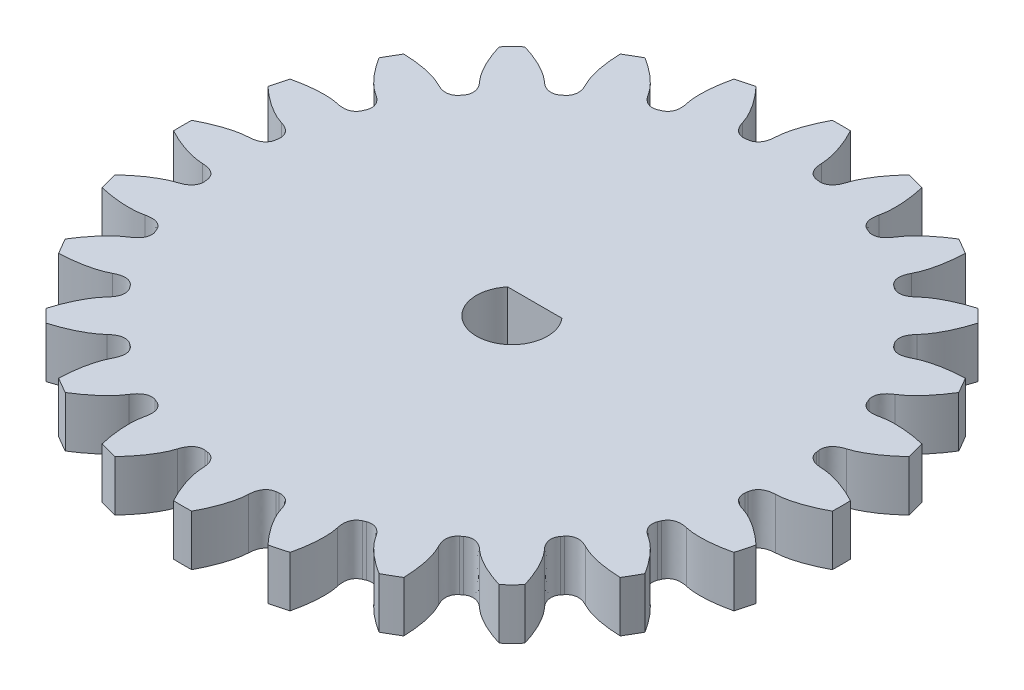
from build123d import *

# Parameters (mm, degrees)
EXTRUDE_1_DEPTH = 2


with BuildPart() as part:
    # Эскиз1 → Бобышка-Вытянуть1 (new body)
    with BuildSketch(Plane(origin=(0, 0, 0), x_dir=(1, 0, 0), z_dir=(0, 1, 0))):
        with BuildLine():
            add(Edge.make_bspline(
                [(0.905776829, 11.30170004), (0.903153797, 11.364174343), (0.897985909, 11.426330365), (0.890273167, 11.488168106), (0.882433861, 11.551020594), (0.871236283, 11.61359405), (0.858868063, 11.675739131), (0.846302347, 11.73887655), (0.831417931, 11.801647657), (0.815287884, 11.863979043), (0.798904868, 11.927287976), (0.780635548, 11.990183506), (0.761176822, 12.052620709), (0.741417879, 12.116021219), (0.720022631, 12.178974672), (0.697502256, 12.241450826), (0.67463984, 12.304875873), (0.650308122, 12.367826515), (0.624909495, 12.430281414), (0.599130965, 12.493670489), (0.572004587, 12.556561325), (0.543862193, 12.618938569), (0.515305116, 12.682234954), (0.485493692, 12.745011445), (0.45471074, 12.807257013), (0.423480821, 12.870406383), (0.391153926, 12.933013083), (0.357730054, 12.995077114)],
                knots=[0, 0, 0, 0, 1, 1, 1, 2, 2, 2, 3, 3, 3, 4, 4, 4, 5, 5, 5, 6, 6, 6, 7, 7, 7, 8, 8, 8, 9, 9, 9, 9], degree=3))
            ThreePointArc((0.357730054, 12.995077114), (0, 13), (-0.357730054, 12.995077114))
            add(Edge.make_bspline(
                [(-0.905776829, 11.30170004), (-0.903153797, 11.364174343), (-0.897985909, 11.426330365), (-0.890273167, 11.488168106), (-0.882433861, 11.551020594), (-0.871236283, 11.61359405), (-0.858868063, 11.675739131), (-0.846302347, 11.73887655), (-0.831417931, 11.801647657), (-0.815287884, 11.863979043), (-0.798904868, 11.927287976), (-0.780635548, 11.990183506), (-0.761176822, 12.052620709), (-0.741417879, 12.116021219), (-0.720022631, 12.178974672), (-0.697502256, 12.241450826), (-0.67463984, 12.304875873), (-0.650308122, 12.367826515), (-0.624909495, 12.430281414), (-0.599130965, 12.493670489), (-0.572004587, 12.556561325), (-0.543862193, 12.618938569), (-0.515305116, 12.682234954), (-0.485493692, 12.745011445), (-0.45471074, 12.807257013), (-0.423480821, 12.870406383), (-0.391153926, 12.933013083), (-0.357730054, 12.995077114)],
                knots=[0, 0, 0, 0, 1, 1, 1, 2, 2, 2, 3, 3, 3, 4, 4, 4, 5, 5, 5, 6, 6, 6, 7, 7, 7, 8, 8, 8, 9, 9, 9, 9], degree=3))
            add(Edge.make_bspline(
                [(-0.905776829, 11.30170004), (-0.905771657, 11.23039326), (-0.913828063, 11.160800255), (-0.929946047, 11.092921025), (-0.939606651, 11.052236386), (-0.951337627, 11.011263415), (-0.96761603, 10.972714088), (-0.979860318, 10.943718059), (-0.994015249, 10.915028809), (-1.010665897, 10.888305341), (-1.024787349, 10.865641106), (-1.040586182, 10.843617085), (-1.057994763, 10.823361181), (-1.073764387, 10.8050123), (-1.090989796, 10.787535026), (-1.10932187, 10.771741608), (-1.126572142, 10.756880182), (-1.145069758, 10.743071473), (-1.164321541, 10.730911074), (-1.182867326, 10.719196619), (-1.202457761, 10.708685073), (-1.222516171, 10.6998039), (-1.242144834, 10.691113003), (-1.262615206, 10.683752451), (-1.283298802, 10.67800565), (-1.303777222, 10.672315856), (-1.324670017, 10.668115352), (-1.345977185, 10.665404138)],
                knots=[0, 0, 0, 0, 1, 1, 1, 2, 2, 2, 3, 3, 3, 4, 4, 4, 5, 5, 5, 6, 6, 6, 7, 7, 7, 8, 8, 8, 9, 9, 9, 9], degree=3))
            ThreePointArc((-1.345977185, 10.665404138), (-1.403156566, 10.65803226), (-1.46029559, 10.650353834))
            add(Edge.make_bspline(
                [(-2.05018198, 11.151036243), (-2.031731423, 11.082157845), (-2.005937537, 11.017021315), (-1.972800323, 10.955626655), (-1.952938937, 10.91882866), (-1.931003099, 10.882288009), (-1.905302069, 10.849265379), (-1.88597027, 10.824426421), (-1.864872333, 10.800378299), (-1.8418725, 10.778874916), (-1.822366288, 10.760637847), (-1.801405552, 10.743453315), (-1.77934754, 10.728393287), (-1.759366213, 10.714751107), (-1.738204295, 10.702327621), (-1.716409234, 10.69181704), (-1.69590033, 10.681926704), (-1.674459048, 10.673376051), (-1.652715911, 10.666612735), (-1.631770134, 10.660097443), (-1.610126638, 10.655014447), (-1.588453086, 10.651627391), (-1.567243883, 10.648312902), (-1.545565971, 10.646501276), (-1.52409977, 10.646303601), (-1.502846508, 10.646107887), (-1.481578448, 10.647457965), (-1.46029559, 10.650353834)],
                knots=[0, 0, 0, 0, 1, 1, 1, 2, 2, 2, 3, 3, 3, 4, 4, 4, 5, 5, 5, 6, 6, 6, 7, 7, 7, 8, 8, 8, 9, 9, 9, 9], degree=3))
            add(Edge.make_bspline(
                [(-2.05018198, 11.151036243), (-2.068885174, 11.210702895), (-2.089964133, 11.269403455), (-2.113418854, 11.327137921), (-2.137258464, 11.385819801), (-2.164269696, 11.443362972), (-2.192300809, 11.50018938), (-2.220779525, 11.557923196), (-2.251403125, 11.614703059), (-2.283116104, 11.670735792), (-2.31532644, 11.727647289), (-2.349251809, 11.783671257), (-2.384207432, 11.838944675), (-2.419702365, 11.895070875), (-2.45666214, 11.950341743), (-2.494585171, 12.004860372), (-2.533084179, 12.060207035), (-2.572879639, 12.114715173), (-2.613577346, 12.168468325), (-2.654883793, 12.223025495), (-2.697363208, 12.276752555), (-2.740691092, 12.329720558), (-2.784657421, 12.383469055), (-2.829700796, 12.436390725), (-2.875545183, 12.488548112), (-2.922055228, 12.541462822), (-2.969484417, 12.593569434), (-3.017832751, 12.64486795)],
                knots=[0, 0, 0, 0, 1, 1, 1, 2, 2, 2, 3, 3, 3, 4, 4, 4, 5, 5, 5, 6, 6, 6, 7, 7, 7, 8, 8, 8, 9, 9, 9, 9], degree=3))
            ThreePointArc((-3.017832751, 12.64486795), (-3.364647586, 12.557035742), (-3.708914148, 12.459693248))
            add(Edge.make_bspline(
                [(-3.800008445, 10.682171655), (-3.813644329, 10.743196089), (-3.824739696, 10.804571744), (-3.833294544, 10.866298619), (-3.841989776, 10.929038422), (-3.847368949, 10.992377886), (-3.851506497, 11.055606556), (-3.855710113, 11.119844866), (-3.857579229, 11.184329469), (-3.85813135, 11.248711729), (-3.85869213, 11.314103698), (-3.857323882, 11.379584563), (-3.854688134, 11.444930559), (-3.85201172, 11.51128474), (-3.847639049, 11.577630603), (-3.842056056, 11.643806636), (-3.836388268, 11.710987756), (-3.829178458, 11.778090919), (-3.820809786, 11.844991368), (-3.812315939, 11.912892486), (-3.802391216, 11.980661192), (-3.791352169, 12.048196771), (-3.78015046, 12.116727499), (-3.767602588, 12.185080697), (-3.753978878, 12.253172513), (-3.740157352, 12.322253018), (-3.725135776, 12.391093263), (-3.708914148, 12.459693248)],
                knots=[0, 0, 0, 0, 1, 1, 1, 2, 2, 2, 3, 3, 3, 4, 4, 4, 5, 5, 5, 6, 6, 6, 7, 7, 7, 8, 8, 8, 9, 9, 9, 9], degree=3))
            add(Edge.make_bspline(
                [(-3.800008445, 10.682171655), (-3.781547896, 10.613295934), (-3.771317792, 10.543989102), (-3.769318131, 10.474251159), (-3.768119598, 10.432452467), (-3.768846266, 10.389839417), (-3.774592696, 10.348390465), (-3.778915046, 10.317213397), (-3.785162334, 10.285838144), (-3.794329082, 10.255715751), (-3.802103423, 10.23016888), (-3.811663687, 10.204806271), (-3.823236471, 10.180734898), (-3.833719719, 10.158929761), (-3.845834734, 10.137589747), (-3.859454521, 10.117589786), (-3.872270584, 10.098770052), (-3.886563952, 10.080644328), (-3.902012404, 10.063915557), (-3.916894333, 10.047800259), (-3.933096651, 10.032576508), (-3.95017297, 10.018806455), (-3.966883434, 10.005331422), (-3.984751244, 9.992923552), (-4.003242682, 9.98201926), (-4.02155069, 9.971223136), (-4.040644409, 9.961758307), (-4.060523839, 9.953624775)],
                knots=[0, 0, 0, 0, 1, 1, 1, 2, 2, 2, 3, 3, 3, 4, 4, 4, 5, 5, 5, 6, 6, 6, 7, 7, 7, 8, 8, 8, 9, 9, 9, 9], degree=3))
            ThreePointArc((-4.060523839, 9.953624775), (-4.113846898, 9.931704974), (-4.167051634, 9.909499517))
            add(Edge.make_bspline(
                [(-4.866424275, 10.240447755), (-4.830775365, 10.178691686), (-4.78900181, 10.122450579), (-4.741103611, 10.071724433), (-4.712394964, 10.041320804), (-4.681749155, 10.011702659), (-4.648376981, 9.986457164), (-4.623275101, 9.96746801), (-4.596671947, 9.949699856), (-4.568890329, 9.934881978), (-4.545328675, 9.922314901), (-4.520634474, 9.911140955), (-4.495430249, 9.902303119), (-4.472598913, 9.894297334), (-4.448942635, 9.887774275), (-4.425169884, 9.883262811), (-4.402799996, 9.879017574), (-4.379876237, 9.876307689), (-4.357123505, 9.875402366), (-4.335205155, 9.874530243), (-4.312983568, 9.875222195), (-4.29117189, 9.877560078), (-4.26982752, 9.879847873), (-4.248419382, 9.883708634), (-4.227633462, 9.889073556), (-4.207053733, 9.89438526), (-4.18685979, 9.901193914), (-4.167051634, 9.909499517)],
                knots=[0, 0, 0, 0, 1, 1, 1, 2, 2, 2, 3, 3, 3, 4, 4, 4, 5, 5, 5, 6, 6, 6, 7, 7, 7, 8, 8, 8, 9, 9, 9, 9], degree=3))
            add(Edge.make_bspline(
                [(-4.866424275, 10.240447755), (-4.89993304, 10.293240572), (-4.935486573, 10.344485323), (-4.973084874, 10.394182006), (-5.011300156, 10.444694204), (-5.052284271, 10.493285618), (-5.094068004, 10.540920727), (-5.136518943, 10.589316478), (-5.180794779, 10.636235643), (-5.225929503, 10.682151183), (-5.271772077, 10.72878682), (-5.319041538, 10.774121286), (-5.36711189, 10.818464127), (-5.415923891, 10.863491108), (-5.465929446, 10.907312773), (-5.51667074, 10.950158522), (-5.568182697, 10.993655017), (-5.620729904, 11.036006012), (-5.67395321, 11.077394228), (-5.727972608, 11.119401513), (-5.782910159, 11.160303386), (-5.838470809, 11.200252466), (-5.894850156, 11.240790204), (-5.952055852, 11.280250529), (-6.009837454, 11.318765296), (-6.068458042, 11.357839295), (-6.127757305, 11.39589484), (-6.187735242, 11.432931932)],
                knots=[0, 0, 0, 0, 1, 1, 1, 2, 2, 2, 3, 3, 3, 4, 4, 4, 5, 5, 5, 6, 6, 6, 7, 7, 7, 8, 8, 8, 9, 9, 9, 9], degree=3))
            ThreePointArc((-6.187735242, 11.432931932), (-6.5, 11.258330249), (-6.807341872, 11.075201878))
            add(Edge.make_bspline(
                [(-6.435275764, 9.334670926), (-6.464241303, 9.390086775), (-6.490843792, 9.446499413), (-6.515083232, 9.503908839), (-6.539720437, 9.562260343), (-6.561309779, 9.622049335), (-6.581671127, 9.682052664), (-6.602357607, 9.743014131), (-6.620852878, 9.804817712), (-6.63804954, 9.866863299), (-6.655515899, 9.929881951), (-6.671141968, 9.993485738), (-6.685508819, 10.057287305), (-6.700097328, 10.122073229), (-6.713045225, 10.187290142), (-6.724780086, 10.252656266), (-6.736693176, 10.319015177), (-6.747096611, 10.385697891), (-6.756328205, 10.452484734), (-6.765697881, 10.520270548), (-6.773651166, 10.588298798), (-6.78046776, 10.656390273), (-6.787384798, 10.725485089), (-6.792955594, 10.794756837), (-6.797419559, 10.864054556), (-6.801948341, 10.934358474), (-6.805255778, 11.004740914), (-6.807341872, 11.075201878)],
                knots=[0, 0, 0, 0, 1, 1, 1, 2, 2, 2, 3, 3, 3, 4, 4, 4, 5, 5, 5, 6, 6, 6, 7, 7, 7, 8, 8, 8, 9, 9, 9, 9], degree=3))
            add(Edge.make_bspline(
                [(-6.435275764, 9.334670926), (-6.399617895, 9.272920029), (-6.371798445, 9.208622516), (-6.351817413, 9.141778386), (-6.339841422, 9.101714154), (-6.32951426, 9.060365032), (-6.324337108, 9.018841134), (-6.320442957, 8.987607692), (-6.318356862, 8.955684607), (-6.319415012, 8.924216081), (-6.320312431, 8.897527551), (-6.322982611, 8.870554774), (-6.327930932, 8.844308356), (-6.332413387, 8.820532946), (-6.338592391, 8.796784479), (-6.346571724, 8.773940941), (-6.354080185, 8.752445432), (-6.363195236, 8.731237931), (-6.373787569, 8.711080826), (-6.383991463, 8.691662917), (-6.395701505, 8.672764433), (-6.40863201, 8.655043907), (-6.421285484, 8.637703038), (-6.435333069, 8.621093427), (-6.450372188, 8.605774754), (-6.465262123, 8.590608037), (-6.481255562, 8.576523897), (-6.498352504, 8.563522332)],
                knots=[0, 0, 0, 0, 1, 1, 1, 2, 2, 2, 3, 3, 3, 4, 4, 4, 5, 5, 5, 6, 6, 6, 7, 7, 7, 8, 8, 8, 9, 9, 9, 9], degree=3))
            ThreePointArc((-6.498352504, 8.563522332), (-6.544185362, 8.528548408), (-6.589829995, 8.493329185))
            add(Edge.make_bspline(
                [(-7.351027799, 8.631989675), (-7.300609948, 8.581564511), (-7.245703523, 8.538051564), (-7.186308524, 8.501450836), (-7.150709061, 8.47951353), (-7.113441743, 8.458836318), (-7.074672683, 8.443088397), (-7.045511375, 8.431243127), (-7.015215964, 8.420965811), (-6.984545833, 8.413843251), (-6.958534424, 8.407802592), (-6.931789628, 8.403400719), (-6.905156815, 8.401387358), (-6.881031389, 8.399563548), (-6.856492887, 8.399385452), (-6.83236252, 8.401180553), (-6.80965612, 8.402869722), (-6.786812099, 8.40618528), (-6.764600332, 8.411199646), (-6.74320311, 8.416030126), (-6.721917795, 8.42244987), (-6.701454421, 8.430353369), (-6.681429467, 8.438087539), (-6.661750033, 8.447357581), (-6.64306092, 8.45791949), (-6.624557198, 8.468376628), (-6.606813556, 8.480179859), (-6.589829995, 8.493329185)],
                knots=[0, 0, 0, 0, 1, 1, 1, 2, 2, 2, 3, 3, 3, 4, 4, 4, 5, 5, 5, 6, 6, 6, 7, 7, 7, 8, 8, 8, 9, 9, 9, 9], degree=3))
            add(Edge.make_bspline(
                [(-7.351027799, 8.631989675), (-7.397058566, 8.674310914), (-7.444663759, 8.714607611), (-7.493843377, 8.752879765), (-7.543830025, 8.791779958), (-7.595994023, 8.828108191), (-7.648682883, 8.863305747), (-7.702213083, 8.89906534), (-7.75712383, 8.932926344), (-7.812604442, 8.965595625), (-7.868955159, 8.998777259), (-7.926347375, 9.030332754), (-7.984256542, 9.060723127), (-8.043059155, 9.091582375), (-8.102702693, 9.120968463), (-8.162804316, 9.149221466), (-8.223818766, 9.177903577), (-8.285536715, 9.20521128), (-8.347658539, 9.231414022), (-8.410709557, 9.258008693), (-8.474361339, 9.283297984), (-8.538368389, 9.307505679), (-8.603318594, 9.332070078), (-8.668788137, 9.355379901), (-8.734569235, 9.37762733), (-8.801305469, 9.40019779), (-8.868433658, 9.421608846), (-8.935953802, 9.441860497)],
                knots=[0, 0, 0, 0, 1, 1, 1, 2, 2, 2, 3, 3, 3, 4, 4, 4, 5, 5, 5, 6, 6, 6, 7, 7, 7, 8, 8, 8, 9, 9, 9, 9], degree=3))
            ThreePointArc((-8.935953802, 9.441860497), (-9.192388155, 9.192388155), (-9.441860497, 8.935953802))
            add(Edge.make_bspline(
                [(-8.631989675, 7.351027799), (-8.674310914, 7.397058566), (-8.714607611, 7.444663759), (-8.752879765, 7.493843377), (-8.791779958, 7.543830025), (-8.828108191, 7.595994023), (-8.863305747, 7.648682883), (-8.89906534, 7.702213083), (-8.932926344, 7.75712383), (-8.965595625, 7.812604442), (-8.998777259, 7.868955159), (-9.030332754, 7.926347375), (-9.060723127, 7.984256542), (-9.091582375, 8.043059155), (-9.120968463, 8.102702693), (-9.149221466, 8.162804316), (-9.177903577, 8.223818766), (-9.20521128, 8.285536715), (-9.231414022, 8.347658539), (-9.258008693, 8.410709557), (-9.283297984, 8.474361339), (-9.307505679, 8.538368389), (-9.332070078, 8.603318594), (-9.355379901, 8.668788137), (-9.37762733, 8.734569235), (-9.40019779, 8.801305469), (-9.421608846, 8.868433658), (-9.441860497, 8.935953802)],
                knots=[0, 0, 0, 0, 1, 1, 1, 2, 2, 2, 3, 3, 3, 4, 4, 4, 5, 5, 5, 6, 6, 6, 7, 7, 7, 8, 8, 8, 9, 9, 9, 9], degree=3))
            add(Edge.make_bspline(
                [(-8.631989675, 7.351027799), (-8.581564511, 7.300609948), (-8.538051564, 7.245703523), (-8.501450836, 7.186308524), (-8.47951353, 7.150709061), (-8.458836318, 7.113441743), (-8.443088397, 7.074672683), (-8.431243127, 7.045511375), (-8.420965811, 7.015215964), (-8.413843251, 6.984545833), (-8.407802592, 6.958534424), (-8.403400719, 6.931789628), (-8.401387358, 6.905156815), (-8.399563548, 6.881031389), (-8.399385452, 6.856492887), (-8.401180553, 6.83236252), (-8.402869722, 6.80965612), (-8.40618528, 6.786812099), (-8.411199646, 6.764600332), (-8.416030126, 6.74320311), (-8.42244987, 6.721917795), (-8.430353369, 6.701454421), (-8.438087539, 6.681429467), (-8.447357581, 6.661750033), (-8.45791949, 6.64306092), (-8.468376628, 6.624557198), (-8.480179859, 6.606813556), (-8.493329185, 6.589829995)],
                knots=[0, 0, 0, 0, 1, 1, 1, 2, 2, 2, 3, 3, 3, 4, 4, 4, 5, 5, 5, 6, 6, 6, 7, 7, 7, 8, 8, 8, 9, 9, 9, 9], degree=3))
            ThreePointArc((-8.493329185, 6.589829995), (-8.528548408, 6.544185362), (-8.563522332, 6.498352504))
            add(Edge.make_bspline(
                [(-9.334670926, 6.435275764), (-9.272920029, 6.399617895), (-9.208622516, 6.371798445), (-9.141778386, 6.351817413), (-9.101714154, 6.339841422), (-9.060365032, 6.32951426), (-9.018841134, 6.324337108), (-8.987607692, 6.320442957), (-8.955684607, 6.318356862), (-8.924216081, 6.319415012), (-8.897527551, 6.320312431), (-8.870554774, 6.322982611), (-8.844308356, 6.327930932), (-8.820532946, 6.332413387), (-8.796784479, 6.338592391), (-8.773940941, 6.346571724), (-8.752445432, 6.354080185), (-8.731237931, 6.363195236), (-8.711080826, 6.373787569), (-8.691662917, 6.383991463), (-8.672764433, 6.395701505), (-8.655043907, 6.40863201), (-8.637703038, 6.421285484), (-8.621093427, 6.435333069), (-8.605774754, 6.450372188), (-8.590608037, 6.465262123), (-8.576523897, 6.481255562), (-8.563522332, 6.498352504)],
                knots=[0, 0, 0, 0, 1, 1, 1, 2, 2, 2, 3, 3, 3, 4, 4, 4, 5, 5, 5, 6, 6, 6, 7, 7, 7, 8, 8, 8, 9, 9, 9, 9], degree=3))
            add(Edge.make_bspline(
                [(-9.334670926, 6.435275764), (-9.390086775, 6.464241303), (-9.446499413, 6.490843792), (-9.503908839, 6.515083232), (-9.562260343, 6.539720437), (-9.622049335, 6.561309779), (-9.682052664, 6.581671127), (-9.743014131, 6.602357607), (-9.804817712, 6.620852878), (-9.866863299, 6.63804954), (-9.929881951, 6.655515899), (-9.993485738, 6.671141968), (-10.057287305, 6.685508819), (-10.122073229, 6.700097328), (-10.187290142, 6.713045225), (-10.252656266, 6.724780086), (-10.319015177, 6.736693176), (-10.385697891, 6.747096611), (-10.452484734, 6.756328205), (-10.520270548, 6.765697881), (-10.588298798, 6.773651166), (-10.656390273, 6.78046776), (-10.725485089, 6.787384798), (-10.794756837, 6.792955594), (-10.864054556, 6.797419559), (-10.934358474, 6.801948341), (-11.004740914, 6.805255778), (-11.075201878, 6.807341872)],
                knots=[0, 0, 0, 0, 1, 1, 1, 2, 2, 2, 3, 3, 3, 4, 4, 4, 5, 5, 5, 6, 6, 6, 7, 7, 7, 8, 8, 8, 9, 9, 9, 9], degree=3))
            ThreePointArc((-11.075201878, 6.807341872), (-11.258330249, 6.5), (-11.432931932, 6.187735242))
            add(Edge.make_bspline(
                [(-10.240447755, 4.866424275), (-10.293240572, 4.89993304), (-10.344485323, 4.935486573), (-10.394182006, 4.973084874), (-10.444694204, 5.011300156), (-10.493285618, 5.052284271), (-10.540920727, 5.094068004), (-10.589316478, 5.136518943), (-10.636235643, 5.180794779), (-10.682151183, 5.225929503), (-10.72878682, 5.271772077), (-10.774121286, 5.319041538), (-10.818464127, 5.36711189), (-10.863491108, 5.415923891), (-10.907312773, 5.465929446), (-10.950158522, 5.51667074), (-10.993655017, 5.568182697), (-11.036006012, 5.620729904), (-11.077394228, 5.67395321), (-11.119401513, 5.727972608), (-11.160303386, 5.782910159), (-11.200252466, 5.838470809), (-11.240790204, 5.894850156), (-11.280250529, 5.952055852), (-11.318765296, 6.009837454), (-11.357839295, 6.068458042), (-11.39589484, 6.127757305), (-11.432931932, 6.187735242)],
                knots=[0, 0, 0, 0, 1, 1, 1, 2, 2, 2, 3, 3, 3, 4, 4, 4, 5, 5, 5, 6, 6, 6, 7, 7, 7, 8, 8, 8, 9, 9, 9, 9], degree=3))
            add(Edge.make_bspline(
                [(-10.240447755, 4.866424275), (-10.178691686, 4.830775365), (-10.122450579, 4.78900181), (-10.071724433, 4.741103611), (-10.041320804, 4.712394964), (-10.011702659, 4.681749155), (-9.986457164, 4.648376981), (-9.96746801, 4.623275101), (-9.949699856, 4.596671947), (-9.934881978, 4.568890329), (-9.922314901, 4.545328675), (-9.911140955, 4.520634474), (-9.902303119, 4.495430249), (-9.894297334, 4.472598913), (-9.887774275, 4.448942635), (-9.883262811, 4.425169884), (-9.879017574, 4.402799996), (-9.876307689, 4.379876237), (-9.875402366, 4.357123505), (-9.874530243, 4.335205155), (-9.875222195, 4.312983568), (-9.877560078, 4.29117189), (-9.879847873, 4.26982752), (-9.883708634, 4.248419382), (-9.889073556, 4.227633462), (-9.89438526, 4.207053733), (-9.901193914, 4.18685979), (-9.909499517, 4.167051634)],
                knots=[0, 0, 0, 0, 1, 1, 1, 2, 2, 2, 3, 3, 3, 4, 4, 4, 5, 5, 5, 6, 6, 6, 7, 7, 7, 8, 8, 8, 9, 9, 9, 9], degree=3))
            ThreePointArc((-9.909499517, 4.167051634), (-9.931704974, 4.113846898), (-9.953624775, 4.060523839))
            add(Edge.make_bspline(
                [(-10.682171655, 3.800008445), (-10.613295934, 3.781547896), (-10.543989102, 3.771317792), (-10.474251159, 3.769318131), (-10.432452467, 3.768119598), (-10.389839417, 3.768846266), (-10.348390465, 3.774592696), (-10.317213397, 3.778915046), (-10.285838144, 3.785162334), (-10.255715751, 3.794329082), (-10.23016888, 3.802103423), (-10.204806271, 3.811663687), (-10.180734898, 3.823236471), (-10.158929761, 3.833719719), (-10.137589747, 3.845834734), (-10.117589786, 3.859454521), (-10.098770052, 3.872270584), (-10.080644328, 3.886563952), (-10.063915557, 3.902012404), (-10.047800259, 3.916894333), (-10.032576508, 3.933096651), (-10.018806455, 3.95017297), (-10.005331422, 3.966883434), (-9.992923552, 3.984751244), (-9.98201926, 4.003242682), (-9.971223136, 4.02155069), (-9.961758307, 4.040644409), (-9.953624775, 4.060523839)],
                knots=[0, 0, 0, 0, 1, 1, 1, 2, 2, 2, 3, 3, 3, 4, 4, 4, 5, 5, 5, 6, 6, 6, 7, 7, 7, 8, 8, 8, 9, 9, 9, 9], degree=3))
            add(Edge.make_bspline(
                [(-10.682171655, 3.800008445), (-10.743196089, 3.813644329), (-10.804571744, 3.824739696), (-10.866298619, 3.833294544), (-10.929038422, 3.841989776), (-10.992377886, 3.847368949), (-11.055606556, 3.851506497), (-11.119844866, 3.855710113), (-11.184329469, 3.857579229), (-11.248711729, 3.85813135), (-11.314103698, 3.85869213), (-11.379584563, 3.857323882), (-11.444930559, 3.854688134), (-11.51128474, 3.85201172), (-11.577630603, 3.847639049), (-11.643806636, 3.842056056), (-11.710987756, 3.836388268), (-11.778090919, 3.829178458), (-11.844991368, 3.820809786), (-11.912892486, 3.812315939), (-11.980661192, 3.802391216), (-12.048196771, 3.791352169), (-12.116727499, 3.78015046), (-12.185080697, 3.767602588), (-12.253172513, 3.753978878), (-12.322253018, 3.740157352), (-12.391093263, 3.725135776), (-12.459693248, 3.708914148)],
                knots=[0, 0, 0, 0, 1, 1, 1, 2, 2, 2, 3, 3, 3, 4, 4, 4, 5, 5, 5, 6, 6, 6, 7, 7, 7, 8, 8, 8, 9, 9, 9, 9], degree=3))
            ThreePointArc((-12.459693248, 3.708914148), (-12.557035742, 3.364647586), (-12.64486795, 3.017832751))
            add(Edge.make_bspline(
                [(-11.151036243, 2.05018198), (-11.210702895, 2.068885174), (-11.269403455, 2.089964133), (-11.327137921, 2.113418854), (-11.385819801, 2.137258464), (-11.443362972, 2.164269696), (-11.50018938, 2.192300809), (-11.557923196, 2.220779525), (-11.614703059, 2.251403125), (-11.670735792, 2.283116104), (-11.727647289, 2.31532644), (-11.783671257, 2.349251809), (-11.838944675, 2.384207432), (-11.895070875, 2.419702365), (-11.950341743, 2.45666214), (-12.004860372, 2.494585171), (-12.060207035, 2.533084179), (-12.114715173, 2.572879639), (-12.168468325, 2.613577346), (-12.223025495, 2.654883793), (-12.276752555, 2.697363208), (-12.329720558, 2.740691092), (-12.383469055, 2.784657421), (-12.436390725, 2.829700796), (-12.488548112, 2.875545183), (-12.541462822, 2.922055228), (-12.593569434, 2.969484417), (-12.64486795, 3.017832751)],
                knots=[0, 0, 0, 0, 1, 1, 1, 2, 2, 2, 3, 3, 3, 4, 4, 4, 5, 5, 5, 6, 6, 6, 7, 7, 7, 8, 8, 8, 9, 9, 9, 9], degree=3))
            add(Edge.make_bspline(
                [(-11.151036243, 2.05018198), (-11.082157845, 2.031731423), (-11.017021315, 2.005937537), (-10.955626655, 1.972800323), (-10.91882866, 1.952938937), (-10.882288009, 1.931003099), (-10.849265379, 1.905302069), (-10.824426421, 1.88597027), (-10.800378299, 1.864872333), (-10.778874916, 1.8418725), (-10.760637847, 1.822366288), (-10.743453315, 1.801405552), (-10.728393287, 1.77934754), (-10.714751107, 1.759366213), (-10.702327621, 1.738204295), (-10.69181704, 1.716409234), (-10.681926704, 1.69590033), (-10.673376051, 1.674459048), (-10.666612735, 1.652715911), (-10.660097443, 1.631770134), (-10.655014447, 1.610126638), (-10.651627391, 1.588453086), (-10.648312902, 1.567243883), (-10.646501276, 1.545565971), (-10.646303601, 1.52409977), (-10.646107887, 1.502846508), (-10.647457965, 1.481578448), (-10.650353834, 1.46029559)],
                knots=[0, 0, 0, 0, 1, 1, 1, 2, 2, 2, 3, 3, 3, 4, 4, 4, 5, 5, 5, 6, 6, 6, 7, 7, 7, 8, 8, 8, 9, 9, 9, 9], degree=3))
            ThreePointArc((-10.650353834, 1.46029559), (-10.65803226, 1.403156566), (-10.665404138, 1.345977185))
            add(Edge.make_bspline(
                [(-11.30170004, 0.905776829), (-11.23039326, 0.905771657), (-11.160800255, 0.913828063), (-11.092921025, 0.929946047), (-11.052236386, 0.939606651), (-11.011263415, 0.951337627), (-10.972714088, 0.96761603), (-10.943718059, 0.979860318), (-10.915028809, 0.994015249), (-10.888305341, 1.010665897), (-10.865641106, 1.024787349), (-10.843617085, 1.040586182), (-10.823361181, 1.057994763), (-10.8050123, 1.073764387), (-10.787535026, 1.090989796), (-10.771741608, 1.10932187), (-10.756880182, 1.126572142), (-10.743071473, 1.145069758), (-10.730911074, 1.164321541), (-10.719196619, 1.182867326), (-10.708685073, 1.202457761), (-10.6998039, 1.222516171), (-10.691113003, 1.242144834), (-10.683752451, 1.262615206), (-10.67800565, 1.283298802), (-10.672315856, 1.303777222), (-10.668115352, 1.324670017), (-10.665404138, 1.345977185)],
                knots=[0, 0, 0, 0, 1, 1, 1, 2, 2, 2, 3, 3, 3, 4, 4, 4, 5, 5, 5, 6, 6, 6, 7, 7, 7, 8, 8, 8, 9, 9, 9, 9], degree=3))
            add(Edge.make_bspline(
                [(-11.30170004, 0.905776829), (-11.364174343, 0.903153797), (-11.426330365, 0.897985909), (-11.488168106, 0.890273167), (-11.551020594, 0.882433861), (-11.61359405, 0.871236283), (-11.675739131, 0.858868063), (-11.73887655, 0.846302347), (-11.801647657, 0.831417931), (-11.863979043, 0.815287884), (-11.927287976, 0.798904868), (-11.990183506, 0.780635548), (-12.052620709, 0.761176822), (-12.116021219, 0.741417879), (-12.178974672, 0.720022631), (-12.241450826, 0.697502256), (-12.304875873, 0.67463984), (-12.367826515, 0.650308122), (-12.430281414, 0.624909495), (-12.493670489, 0.599130965), (-12.556561325, 0.572004587), (-12.618938569, 0.543862193), (-12.682234954, 0.515305116), (-12.745011445, 0.485493692), (-12.807257013, 0.45471074), (-12.870406383, 0.423480821), (-12.933013083, 0.391153926), (-12.995077114, 0.357730054)],
                knots=[0, 0, 0, 0, 1, 1, 1, 2, 2, 2, 3, 3, 3, 4, 4, 4, 5, 5, 5, 6, 6, 6, 7, 7, 7, 8, 8, 8, 9, 9, 9, 9], degree=3))
            ThreePointArc((-12.995077114, 0.357730054), (-13, 0), (-12.995077114, -0.357730054))
            add(Edge.make_bspline(
                [(-11.30170004, -0.905776829), (-11.364174343, -0.903153797), (-11.426330365, -0.897985909), (-11.488168106, -0.890273167), (-11.551020594, -0.882433861), (-11.61359405, -0.871236283), (-11.675739131, -0.858868063), (-11.73887655, -0.846302347), (-11.801647657, -0.831417931), (-11.863979043, -0.815287884), (-11.927287976, -0.798904868), (-11.990183506, -0.780635548), (-12.052620709, -0.761176822), (-12.116021219, -0.741417879), (-12.178974672, -0.720022631), (-12.241450826, -0.697502256), (-12.304875873, -0.67463984), (-12.367826515, -0.650308122), (-12.430281414, -0.624909495), (-12.493670489, -0.599130965), (-12.556561325, -0.572004587), (-12.618938569, -0.543862193), (-12.682234954, -0.515305116), (-12.745011445, -0.485493692), (-12.807257013, -0.45471074), (-12.870406383, -0.423480821), (-12.933013083, -0.391153926), (-12.995077114, -0.357730054)],
                knots=[0, 0, 0, 0, 1, 1, 1, 2, 2, 2, 3, 3, 3, 4, 4, 4, 5, 5, 5, 6, 6, 6, 7, 7, 7, 8, 8, 8, 9, 9, 9, 9], degree=3))
            add(Edge.make_bspline(
                [(-11.30170004, -0.905776829), (-11.23039326, -0.905771657), (-11.160800255, -0.913828063), (-11.092921025, -0.929946047), (-11.052236386, -0.939606651), (-11.011263415, -0.951337627), (-10.972714088, -0.96761603), (-10.943718059, -0.979860318), (-10.915028809, -0.994015249), (-10.888305341, -1.010665897), (-10.865641106, -1.024787349), (-10.843617085, -1.040586182), (-10.823361181, -1.057994763), (-10.8050123, -1.073764387), (-10.787535026, -1.090989796), (-10.771741608, -1.10932187), (-10.756880182, -1.126572142), (-10.743071473, -1.145069758), (-10.730911074, -1.164321541), (-10.719196619, -1.182867326), (-10.708685073, -1.202457761), (-10.6998039, -1.222516171), (-10.691113003, -1.242144834), (-10.683752451, -1.262615206), (-10.67800565, -1.283298802), (-10.672315856, -1.303777222), (-10.668115352, -1.324670017), (-10.665404138, -1.345977185)],
                knots=[0, 0, 0, 0, 1, 1, 1, 2, 2, 2, 3, 3, 3, 4, 4, 4, 5, 5, 5, 6, 6, 6, 7, 7, 7, 8, 8, 8, 9, 9, 9, 9], degree=3))
            ThreePointArc((-10.665404138, -1.345977185), (-10.65803226, -1.403156566), (-10.650353834, -1.46029559))
            add(Edge.make_bspline(
                [(-11.151036243, -2.05018198), (-11.082157845, -2.031731423), (-11.017021315, -2.005937537), (-10.955626655, -1.972800323), (-10.91882866, -1.952938937), (-10.882288009, -1.931003099), (-10.849265379, -1.905302069), (-10.824426421, -1.88597027), (-10.800378299, -1.864872333), (-10.778874916, -1.8418725), (-10.760637847, -1.822366288), (-10.743453315, -1.801405552), (-10.728393287, -1.77934754), (-10.714751107, -1.759366213), (-10.702327621, -1.738204295), (-10.69181704, -1.716409234), (-10.681926704, -1.69590033), (-10.673376051, -1.674459048), (-10.666612735, -1.652715911), (-10.660097443, -1.631770134), (-10.655014447, -1.610126638), (-10.651627391, -1.588453086), (-10.648312902, -1.567243883), (-10.646501276, -1.545565971), (-10.646303601, -1.52409977), (-10.646107887, -1.502846508), (-10.647457965, -1.481578448), (-10.650353834, -1.46029559)],
                knots=[0, 0, 0, 0, 1, 1, 1, 2, 2, 2, 3, 3, 3, 4, 4, 4, 5, 5, 5, 6, 6, 6, 7, 7, 7, 8, 8, 8, 9, 9, 9, 9], degree=3))
            add(Edge.make_bspline(
                [(-11.151036243, -2.05018198), (-11.210702895, -2.068885174), (-11.269403455, -2.089964133), (-11.327137921, -2.113418854), (-11.385819801, -2.137258464), (-11.443362972, -2.164269696), (-11.50018938, -2.192300809), (-11.557923196, -2.220779525), (-11.614703059, -2.251403125), (-11.670735792, -2.283116104), (-11.727647289, -2.31532644), (-11.783671257, -2.349251809), (-11.838944675, -2.384207432), (-11.895070875, -2.419702365), (-11.950341743, -2.45666214), (-12.004860372, -2.494585171), (-12.060207035, -2.533084179), (-12.114715173, -2.572879639), (-12.168468325, -2.613577346), (-12.223025495, -2.654883793), (-12.276752555, -2.697363208), (-12.329720558, -2.740691092), (-12.383469055, -2.784657421), (-12.436390725, -2.829700796), (-12.488548112, -2.875545183), (-12.541462822, -2.922055228), (-12.593569434, -2.969484417), (-12.64486795, -3.017832751)],
                knots=[0, 0, 0, 0, 1, 1, 1, 2, 2, 2, 3, 3, 3, 4, 4, 4, 5, 5, 5, 6, 6, 6, 7, 7, 7, 8, 8, 8, 9, 9, 9, 9], degree=3))
            ThreePointArc((-12.64486795, -3.017832751), (-12.557035742, -3.364647586), (-12.459693248, -3.708914148))
            add(Edge.make_bspline(
                [(-10.682171655, -3.800008445), (-10.743196089, -3.813644329), (-10.804571744, -3.824739696), (-10.866298619, -3.833294544), (-10.929038422, -3.841989776), (-10.992377886, -3.847368949), (-11.055606556, -3.851506497), (-11.119844866, -3.855710113), (-11.184329469, -3.857579229), (-11.248711729, -3.85813135), (-11.314103698, -3.85869213), (-11.379584563, -3.857323882), (-11.444930559, -3.854688134), (-11.51128474, -3.85201172), (-11.577630603, -3.847639049), (-11.643806636, -3.842056056), (-11.710987756, -3.836388268), (-11.778090919, -3.829178458), (-11.844991368, -3.820809786), (-11.912892486, -3.812315939), (-11.980661192, -3.802391216), (-12.048196771, -3.791352169), (-12.116727499, -3.78015046), (-12.185080697, -3.767602588), (-12.253172513, -3.753978878), (-12.322253018, -3.740157352), (-12.391093263, -3.725135776), (-12.459693248, -3.708914148)],
                knots=[0, 0, 0, 0, 1, 1, 1, 2, 2, 2, 3, 3, 3, 4, 4, 4, 5, 5, 5, 6, 6, 6, 7, 7, 7, 8, 8, 8, 9, 9, 9, 9], degree=3))
            add(Edge.make_bspline(
                [(-10.682171655, -3.800008445), (-10.613295934, -3.781547896), (-10.543989102, -3.771317792), (-10.474251159, -3.769318131), (-10.432452467, -3.768119598), (-10.389839417, -3.768846266), (-10.348390465, -3.774592696), (-10.317213397, -3.778915046), (-10.285838144, -3.785162334), (-10.255715751, -3.794329082), (-10.23016888, -3.802103423), (-10.204806271, -3.811663687), (-10.180734898, -3.823236471), (-10.158929761, -3.833719719), (-10.137589747, -3.845834734), (-10.117589786, -3.859454521), (-10.098770052, -3.872270584), (-10.080644328, -3.886563952), (-10.063915557, -3.902012404), (-10.047800259, -3.916894333), (-10.032576508, -3.933096651), (-10.018806455, -3.95017297), (-10.005331422, -3.966883434), (-9.992923552, -3.984751244), (-9.98201926, -4.003242682), (-9.971223136, -4.02155069), (-9.961758307, -4.040644409), (-9.953624775, -4.060523839)],
                knots=[0, 0, 0, 0, 1, 1, 1, 2, 2, 2, 3, 3, 3, 4, 4, 4, 5, 5, 5, 6, 6, 6, 7, 7, 7, 8, 8, 8, 9, 9, 9, 9], degree=3))
            ThreePointArc((-9.953624775, -4.060523839), (-9.931704974, -4.113846898), (-9.909499517, -4.167051634))
            add(Edge.make_bspline(
                [(-10.240447755, -4.866424275), (-10.178691686, -4.830775365), (-10.122450579, -4.78900181), (-10.071724433, -4.741103611), (-10.041320804, -4.712394964), (-10.011702659, -4.681749155), (-9.986457164, -4.648376981), (-9.96746801, -4.623275101), (-9.949699856, -4.596671947), (-9.934881978, -4.568890329), (-9.922314901, -4.545328675), (-9.911140955, -4.520634474), (-9.902303119, -4.495430249), (-9.894297334, -4.472598913), (-9.887774275, -4.448942635), (-9.883262811, -4.425169884), (-9.879017574, -4.402799996), (-9.876307689, -4.379876237), (-9.875402366, -4.357123505), (-9.874530243, -4.335205155), (-9.875222195, -4.312983568), (-9.877560078, -4.29117189), (-9.879847873, -4.26982752), (-9.883708634, -4.248419382), (-9.889073556, -4.227633462), (-9.89438526, -4.207053733), (-9.901193914, -4.18685979), (-9.909499517, -4.167051634)],
                knots=[0, 0, 0, 0, 1, 1, 1, 2, 2, 2, 3, 3, 3, 4, 4, 4, 5, 5, 5, 6, 6, 6, 7, 7, 7, 8, 8, 8, 9, 9, 9, 9], degree=3))
            add(Edge.make_bspline(
                [(-10.240447755, -4.866424275), (-10.293240572, -4.89993304), (-10.344485323, -4.935486573), (-10.394182006, -4.973084874), (-10.444694204, -5.011300156), (-10.493285618, -5.052284271), (-10.540920727, -5.094068004), (-10.589316478, -5.136518943), (-10.636235643, -5.180794779), (-10.682151183, -5.225929503), (-10.72878682, -5.271772077), (-10.774121286, -5.319041538), (-10.818464127, -5.36711189), (-10.863491108, -5.415923891), (-10.907312773, -5.465929446), (-10.950158522, -5.51667074), (-10.993655017, -5.568182697), (-11.036006012, -5.620729904), (-11.077394228, -5.67395321), (-11.119401513, -5.727972608), (-11.160303386, -5.782910159), (-11.200252466, -5.838470809), (-11.240790204, -5.894850156), (-11.280250529, -5.952055852), (-11.318765296, -6.009837454), (-11.357839295, -6.068458042), (-11.39589484, -6.127757305), (-11.432931932, -6.187735242)],
                knots=[0, 0, 0, 0, 1, 1, 1, 2, 2, 2, 3, 3, 3, 4, 4, 4, 5, 5, 5, 6, 6, 6, 7, 7, 7, 8, 8, 8, 9, 9, 9, 9], degree=3))
            ThreePointArc((-11.432931932, -6.187735242), (-11.258330249, -6.5), (-11.075201878, -6.807341872))
            add(Edge.make_bspline(
                [(-9.334670926, -6.435275764), (-9.390086775, -6.464241303), (-9.446499413, -6.490843792), (-9.503908839, -6.515083232), (-9.562260343, -6.539720437), (-9.622049335, -6.561309779), (-9.682052664, -6.581671127), (-9.743014131, -6.602357607), (-9.804817712, -6.620852878), (-9.866863299, -6.63804954), (-9.929881951, -6.655515899), (-9.993485738, -6.671141968), (-10.057287305, -6.685508819), (-10.122073229, -6.700097328), (-10.187290142, -6.713045225), (-10.252656266, -6.724780086), (-10.319015177, -6.736693176), (-10.385697891, -6.747096611), (-10.452484734, -6.756328205), (-10.520270548, -6.765697881), (-10.588298798, -6.773651166), (-10.656390273, -6.78046776), (-10.725485089, -6.787384798), (-10.794756837, -6.792955594), (-10.864054556, -6.797419559), (-10.934358474, -6.801948341), (-11.004740914, -6.805255778), (-11.075201878, -6.807341872)],
                knots=[0, 0, 0, 0, 1, 1, 1, 2, 2, 2, 3, 3, 3, 4, 4, 4, 5, 5, 5, 6, 6, 6, 7, 7, 7, 8, 8, 8, 9, 9, 9, 9], degree=3))
            add(Edge.make_bspline(
                [(-9.334670926, -6.435275764), (-9.272920029, -6.399617895), (-9.208622516, -6.371798445), (-9.141778386, -6.351817413), (-9.101714154, -6.339841422), (-9.060365032, -6.32951426), (-9.018841134, -6.324337108), (-8.987607692, -6.320442957), (-8.955684607, -6.318356862), (-8.924216081, -6.319415012), (-8.897527551, -6.320312431), (-8.870554774, -6.322982611), (-8.844308356, -6.327930932), (-8.820532946, -6.332413387), (-8.796784479, -6.338592391), (-8.773940941, -6.346571724), (-8.752445432, -6.354080185), (-8.731237931, -6.363195236), (-8.711080826, -6.373787569), (-8.691662917, -6.383991463), (-8.672764433, -6.395701505), (-8.655043907, -6.40863201), (-8.637703038, -6.421285484), (-8.621093427, -6.435333069), (-8.605774754, -6.450372188), (-8.590608037, -6.465262123), (-8.576523897, -6.481255562), (-8.563522332, -6.498352504)],
                knots=[0, 0, 0, 0, 1, 1, 1, 2, 2, 2, 3, 3, 3, 4, 4, 4, 5, 5, 5, 6, 6, 6, 7, 7, 7, 8, 8, 8, 9, 9, 9, 9], degree=3))
            ThreePointArc((-8.563522332, -6.498352504), (-8.528548408, -6.544185362), (-8.493329185, -6.589829995))
            add(Edge.make_bspline(
                [(-8.631989675, -7.351027799), (-8.581564511, -7.300609948), (-8.538051564, -7.245703523), (-8.501450836, -7.186308524), (-8.47951353, -7.150709061), (-8.458836318, -7.113441743), (-8.443088397, -7.074672683), (-8.431243127, -7.045511375), (-8.420965811, -7.015215964), (-8.413843251, -6.984545833), (-8.407802592, -6.958534424), (-8.403400719, -6.931789628), (-8.401387358, -6.905156815), (-8.399563548, -6.881031389), (-8.399385452, -6.856492887), (-8.401180553, -6.83236252), (-8.402869722, -6.80965612), (-8.40618528, -6.786812099), (-8.411199646, -6.764600332), (-8.416030126, -6.74320311), (-8.42244987, -6.721917795), (-8.430353369, -6.701454421), (-8.438087539, -6.681429467), (-8.447357581, -6.661750033), (-8.45791949, -6.64306092), (-8.468376628, -6.624557198), (-8.480179859, -6.606813556), (-8.493329185, -6.589829995)],
                knots=[0, 0, 0, 0, 1, 1, 1, 2, 2, 2, 3, 3, 3, 4, 4, 4, 5, 5, 5, 6, 6, 6, 7, 7, 7, 8, 8, 8, 9, 9, 9, 9], degree=3))
            add(Edge.make_bspline(
                [(-8.631989675, -7.351027799), (-8.674310914, -7.397058566), (-8.714607611, -7.444663759), (-8.752879765, -7.493843377), (-8.791779958, -7.543830025), (-8.828108191, -7.595994023), (-8.863305747, -7.648682883), (-8.89906534, -7.702213083), (-8.932926344, -7.75712383), (-8.965595625, -7.812604442), (-8.998777259, -7.868955159), (-9.030332754, -7.926347375), (-9.060723127, -7.984256542), (-9.091582375, -8.043059155), (-9.120968463, -8.102702693), (-9.149221466, -8.162804316), (-9.177903577, -8.223818766), (-9.20521128, -8.285536715), (-9.231414022, -8.347658539), (-9.258008693, -8.410709557), (-9.283297984, -8.474361339), (-9.307505679, -8.538368389), (-9.332070078, -8.603318594), (-9.355379901, -8.668788137), (-9.37762733, -8.734569235), (-9.40019779, -8.801305469), (-9.421608846, -8.868433658), (-9.441860497, -8.935953802)],
                knots=[0, 0, 0, 0, 1, 1, 1, 2, 2, 2, 3, 3, 3, 4, 4, 4, 5, 5, 5, 6, 6, 6, 7, 7, 7, 8, 8, 8, 9, 9, 9, 9], degree=3))
            ThreePointArc((-9.441860497, -8.935953802), (-9.192388155, -9.192388155), (-8.935953802, -9.441860497))
            add(Edge.make_bspline(
                [(-7.351027799, -8.631989675), (-7.397058566, -8.674310914), (-7.444663759, -8.714607611), (-7.493843377, -8.752879765), (-7.543830025, -8.791779958), (-7.595994023, -8.828108191), (-7.648682883, -8.863305747), (-7.702213083, -8.89906534), (-7.75712383, -8.932926344), (-7.812604442, -8.965595625), (-7.868955159, -8.998777259), (-7.926347375, -9.030332754), (-7.984256542, -9.060723127), (-8.043059155, -9.091582375), (-8.102702693, -9.120968463), (-8.162804316, -9.149221466), (-8.223818766, -9.177903577), (-8.285536715, -9.20521128), (-8.347658539, -9.231414022), (-8.410709557, -9.258008693), (-8.474361339, -9.283297984), (-8.538368389, -9.307505679), (-8.603318594, -9.332070078), (-8.668788137, -9.355379901), (-8.734569235, -9.37762733), (-8.801305469, -9.40019779), (-8.868433658, -9.421608846), (-8.935953802, -9.441860497)],
                knots=[0, 0, 0, 0, 1, 1, 1, 2, 2, 2, 3, 3, 3, 4, 4, 4, 5, 5, 5, 6, 6, 6, 7, 7, 7, 8, 8, 8, 9, 9, 9, 9], degree=3))
            add(Edge.make_bspline(
                [(-7.351027799, -8.631989675), (-7.300609948, -8.581564511), (-7.245703523, -8.538051564), (-7.186308524, -8.501450836), (-7.150709061, -8.47951353), (-7.113441743, -8.458836318), (-7.074672683, -8.443088397), (-7.045511375, -8.431243127), (-7.015215964, -8.420965811), (-6.984545833, -8.413843251), (-6.958534424, -8.407802592), (-6.931789628, -8.403400719), (-6.905156815, -8.401387358), (-6.881031389, -8.399563548), (-6.856492887, -8.399385452), (-6.83236252, -8.401180553), (-6.80965612, -8.402869722), (-6.786812099, -8.40618528), (-6.764600332, -8.411199646), (-6.74320311, -8.416030126), (-6.721917795, -8.42244987), (-6.701454421, -8.430353369), (-6.681429467, -8.438087539), (-6.661750033, -8.447357581), (-6.64306092, -8.45791949), (-6.624557198, -8.468376628), (-6.606813556, -8.480179859), (-6.589829995, -8.493329185)],
                knots=[0, 0, 0, 0, 1, 1, 1, 2, 2, 2, 3, 3, 3, 4, 4, 4, 5, 5, 5, 6, 6, 6, 7, 7, 7, 8, 8, 8, 9, 9, 9, 9], degree=3))
            ThreePointArc((-6.589829995, -8.493329185), (-6.544185362, -8.528548408), (-6.498352504, -8.563522332))
            add(Edge.make_bspline(
                [(-6.435275764, -9.334670926), (-6.399617895, -9.272920029), (-6.371798445, -9.208622516), (-6.351817413, -9.141778386), (-6.339841422, -9.101714154), (-6.32951426, -9.060365032), (-6.324337108, -9.018841134), (-6.320442957, -8.987607692), (-6.318356862, -8.955684607), (-6.319415012, -8.924216081), (-6.320312431, -8.897527551), (-6.322982611, -8.870554774), (-6.327930932, -8.844308356), (-6.332413387, -8.820532946), (-6.338592391, -8.796784479), (-6.346571724, -8.773940941), (-6.354080185, -8.752445432), (-6.363195236, -8.731237931), (-6.373787569, -8.711080826), (-6.383991463, -8.691662917), (-6.395701505, -8.672764433), (-6.40863201, -8.655043907), (-6.421285484, -8.637703038), (-6.435333069, -8.621093427), (-6.450372188, -8.605774754), (-6.465262123, -8.590608037), (-6.481255562, -8.576523897), (-6.498352504, -8.563522332)],
                knots=[0, 0, 0, 0, 1, 1, 1, 2, 2, 2, 3, 3, 3, 4, 4, 4, 5, 5, 5, 6, 6, 6, 7, 7, 7, 8, 8, 8, 9, 9, 9, 9], degree=3))
            add(Edge.make_bspline(
                [(-6.435275764, -9.334670926), (-6.464241303, -9.390086775), (-6.490843792, -9.446499413), (-6.515083232, -9.503908839), (-6.539720437, -9.562260343), (-6.561309779, -9.622049335), (-6.581671127, -9.682052664), (-6.602357607, -9.743014131), (-6.620852878, -9.804817712), (-6.63804954, -9.866863299), (-6.655515899, -9.929881951), (-6.671141968, -9.993485738), (-6.685508819, -10.057287305), (-6.700097328, -10.122073229), (-6.713045225, -10.187290142), (-6.724780086, -10.252656266), (-6.736693176, -10.319015177), (-6.747096611, -10.385697891), (-6.756328205, -10.452484734), (-6.765697881, -10.520270548), (-6.773651166, -10.588298798), (-6.78046776, -10.656390273), (-6.787384798, -10.725485089), (-6.792955594, -10.794756837), (-6.797419559, -10.864054556), (-6.801948341, -10.934358474), (-6.805255778, -11.004740914), (-6.807341872, -11.075201878)],
                knots=[0, 0, 0, 0, 1, 1, 1, 2, 2, 2, 3, 3, 3, 4, 4, 4, 5, 5, 5, 6, 6, 6, 7, 7, 7, 8, 8, 8, 9, 9, 9, 9], degree=3))
            ThreePointArc((-6.807341872, -11.075201878), (-6.5, -11.258330249), (-6.187735242, -11.432931932))
            add(Edge.make_bspline(
                [(-4.866424275, -10.240447755), (-4.89993304, -10.293240572), (-4.935486573, -10.344485323), (-4.973084874, -10.394182006), (-5.011300156, -10.444694204), (-5.052284271, -10.493285618), (-5.094068004, -10.540920727), (-5.136518943, -10.589316478), (-5.180794779, -10.636235643), (-5.225929503, -10.682151183), (-5.271772077, -10.72878682), (-5.319041538, -10.774121286), (-5.36711189, -10.818464127), (-5.415923891, -10.863491108), (-5.465929446, -10.907312773), (-5.51667074, -10.950158522), (-5.568182697, -10.993655017), (-5.620729904, -11.036006012), (-5.67395321, -11.077394228), (-5.727972608, -11.119401513), (-5.782910159, -11.160303386), (-5.838470809, -11.200252466), (-5.894850156, -11.240790204), (-5.952055852, -11.280250529), (-6.009837454, -11.318765296), (-6.068458042, -11.357839295), (-6.127757305, -11.39589484), (-6.187735242, -11.432931932)],
                knots=[0, 0, 0, 0, 1, 1, 1, 2, 2, 2, 3, 3, 3, 4, 4, 4, 5, 5, 5, 6, 6, 6, 7, 7, 7, 8, 8, 8, 9, 9, 9, 9], degree=3))
            add(Edge.make_bspline(
                [(-4.866424275, -10.240447755), (-4.830775365, -10.178691686), (-4.78900181, -10.122450579), (-4.741103611, -10.071724433), (-4.712394964, -10.041320804), (-4.681749155, -10.011702659), (-4.648376981, -9.986457164), (-4.623275101, -9.96746801), (-4.596671947, -9.949699856), (-4.568890329, -9.934881978), (-4.545328675, -9.922314901), (-4.520634474, -9.911140955), (-4.495430249, -9.902303119), (-4.472598913, -9.894297334), (-4.448942635, -9.887774275), (-4.425169884, -9.883262811), (-4.402799996, -9.879017574), (-4.379876237, -9.876307689), (-4.357123505, -9.875402366), (-4.335205155, -9.874530243), (-4.312983568, -9.875222195), (-4.29117189, -9.877560078), (-4.26982752, -9.879847873), (-4.248419382, -9.883708634), (-4.227633462, -9.889073556), (-4.207053733, -9.89438526), (-4.18685979, -9.901193914), (-4.167051634, -9.909499517)],
                knots=[0, 0, 0, 0, 1, 1, 1, 2, 2, 2, 3, 3, 3, 4, 4, 4, 5, 5, 5, 6, 6, 6, 7, 7, 7, 8, 8, 8, 9, 9, 9, 9], degree=3))
            ThreePointArc((-4.167051634, -9.909499517), (-4.113846898, -9.931704974), (-4.060523839, -9.953624775))
            add(Edge.make_bspline(
                [(-3.800008445, -10.682171655), (-3.781547896, -10.613295934), (-3.771317792, -10.543989102), (-3.769318131, -10.474251159), (-3.768119598, -10.432452467), (-3.768846266, -10.389839417), (-3.774592696, -10.348390465), (-3.778915046, -10.317213397), (-3.785162334, -10.285838144), (-3.794329082, -10.255715751), (-3.802103423, -10.23016888), (-3.811663687, -10.204806271), (-3.823236471, -10.180734898), (-3.833719719, -10.158929761), (-3.845834734, -10.137589747), (-3.859454521, -10.117589786), (-3.872270584, -10.098770052), (-3.886563952, -10.080644328), (-3.902012404, -10.063915557), (-3.916894333, -10.047800259), (-3.933096651, -10.032576508), (-3.95017297, -10.018806455), (-3.966883434, -10.005331422), (-3.984751244, -9.992923552), (-4.003242682, -9.98201926), (-4.02155069, -9.971223136), (-4.040644409, -9.961758307), (-4.060523839, -9.953624775)],
                knots=[0, 0, 0, 0, 1, 1, 1, 2, 2, 2, 3, 3, 3, 4, 4, 4, 5, 5, 5, 6, 6, 6, 7, 7, 7, 8, 8, 8, 9, 9, 9, 9], degree=3))
            add(Edge.make_bspline(
                [(-3.800008445, -10.682171655), (-3.813644329, -10.743196089), (-3.824739696, -10.804571744), (-3.833294544, -10.866298619), (-3.841989776, -10.929038422), (-3.847368949, -10.992377886), (-3.851506497, -11.055606556), (-3.855710113, -11.119844866), (-3.857579229, -11.184329469), (-3.85813135, -11.248711729), (-3.85869213, -11.314103698), (-3.857323882, -11.379584563), (-3.854688134, -11.444930559), (-3.85201172, -11.51128474), (-3.847639049, -11.577630603), (-3.842056056, -11.643806636), (-3.836388268, -11.710987756), (-3.829178458, -11.778090919), (-3.820809786, -11.844991368), (-3.812315939, -11.912892486), (-3.802391216, -11.980661192), (-3.791352169, -12.048196771), (-3.78015046, -12.116727499), (-3.767602588, -12.185080697), (-3.753978878, -12.253172513), (-3.740157352, -12.322253018), (-3.725135776, -12.391093263), (-3.708914148, -12.459693248)],
                knots=[0, 0, 0, 0, 1, 1, 1, 2, 2, 2, 3, 3, 3, 4, 4, 4, 5, 5, 5, 6, 6, 6, 7, 7, 7, 8, 8, 8, 9, 9, 9, 9], degree=3))
            ThreePointArc((-3.708914148, -12.459693248), (-3.364647586, -12.557035742), (-3.017832751, -12.64486795))
            add(Edge.make_bspline(
                [(-2.05018198, -11.151036243), (-2.068885174, -11.210702895), (-2.089964133, -11.269403455), (-2.113418854, -11.327137921), (-2.137258464, -11.385819801), (-2.164269696, -11.443362972), (-2.192300809, -11.50018938), (-2.220779525, -11.557923196), (-2.251403125, -11.614703059), (-2.283116104, -11.670735792), (-2.31532644, -11.727647289), (-2.349251809, -11.783671257), (-2.384207432, -11.838944675), (-2.419702365, -11.895070875), (-2.45666214, -11.950341743), (-2.494585171, -12.004860372), (-2.533084179, -12.060207035), (-2.572879639, -12.114715173), (-2.613577346, -12.168468325), (-2.654883793, -12.223025495), (-2.697363208, -12.276752555), (-2.740691092, -12.329720558), (-2.784657421, -12.383469055), (-2.829700796, -12.436390725), (-2.875545183, -12.488548112), (-2.922055228, -12.541462822), (-2.969484417, -12.593569434), (-3.017832751, -12.64486795)],
                knots=[0, 0, 0, 0, 1, 1, 1, 2, 2, 2, 3, 3, 3, 4, 4, 4, 5, 5, 5, 6, 6, 6, 7, 7, 7, 8, 8, 8, 9, 9, 9, 9], degree=3))
            add(Edge.make_bspline(
                [(-2.05018198, -11.151036243), (-2.031731423, -11.082157845), (-2.005937537, -11.017021315), (-1.972800323, -10.955626655), (-1.952938937, -10.91882866), (-1.931003099, -10.882288009), (-1.905302069, -10.849265379), (-1.88597027, -10.824426421), (-1.864872333, -10.800378299), (-1.8418725, -10.778874916), (-1.822366288, -10.760637847), (-1.801405552, -10.743453315), (-1.77934754, -10.728393287), (-1.759366213, -10.714751107), (-1.738204295, -10.702327621), (-1.716409234, -10.69181704), (-1.69590033, -10.681926704), (-1.674459048, -10.673376051), (-1.652715911, -10.666612735), (-1.631770134, -10.660097443), (-1.610126638, -10.655014447), (-1.588453086, -10.651627391), (-1.567243883, -10.648312902), (-1.545565971, -10.646501276), (-1.52409977, -10.646303601), (-1.502846508, -10.646107887), (-1.481578448, -10.647457965), (-1.46029559, -10.650353834)],
                knots=[0, 0, 0, 0, 1, 1, 1, 2, 2, 2, 3, 3, 3, 4, 4, 4, 5, 5, 5, 6, 6, 6, 7, 7, 7, 8, 8, 8, 9, 9, 9, 9], degree=3))
            ThreePointArc((-1.46029559, -10.650353834), (-1.403156566, -10.65803226), (-1.345977185, -10.665404138))
            add(Edge.make_bspline(
                [(-0.905776829, -11.30170004), (-0.905771657, -11.23039326), (-0.913828063, -11.160800255), (-0.929946047, -11.092921025), (-0.939606651, -11.052236386), (-0.951337627, -11.011263415), (-0.96761603, -10.972714088), (-0.979860318, -10.943718059), (-0.994015249, -10.915028809), (-1.010665897, -10.888305341), (-1.024787349, -10.865641106), (-1.040586182, -10.843617085), (-1.057994763, -10.823361181), (-1.073764387, -10.8050123), (-1.090989796, -10.787535026), (-1.10932187, -10.771741608), (-1.126572142, -10.756880182), (-1.145069758, -10.743071473), (-1.164321541, -10.730911074), (-1.182867326, -10.719196619), (-1.202457761, -10.708685073), (-1.222516171, -10.6998039), (-1.242144834, -10.691113003), (-1.262615206, -10.683752451), (-1.283298802, -10.67800565), (-1.303777222, -10.672315856), (-1.324670017, -10.668115352), (-1.345977185, -10.665404138)],
                knots=[0, 0, 0, 0, 1, 1, 1, 2, 2, 2, 3, 3, 3, 4, 4, 4, 5, 5, 5, 6, 6, 6, 7, 7, 7, 8, 8, 8, 9, 9, 9, 9], degree=3))
            add(Edge.make_bspline(
                [(-0.905776829, -11.30170004), (-0.903153797, -11.364174343), (-0.897985909, -11.426330365), (-0.890273167, -11.488168106), (-0.882433861, -11.551020594), (-0.871236283, -11.61359405), (-0.858868063, -11.675739131), (-0.846302347, -11.73887655), (-0.831417931, -11.801647657), (-0.815287884, -11.863979043), (-0.798904868, -11.927287976), (-0.780635548, -11.990183506), (-0.761176822, -12.052620709), (-0.741417879, -12.116021219), (-0.720022631, -12.178974672), (-0.697502256, -12.241450826), (-0.67463984, -12.304875873), (-0.650308122, -12.367826515), (-0.624909495, -12.430281414), (-0.599130965, -12.493670489), (-0.572004587, -12.556561325), (-0.543862193, -12.618938569), (-0.515305116, -12.682234954), (-0.485493692, -12.745011445), (-0.45471074, -12.807257013), (-0.423480821, -12.870406383), (-0.391153926, -12.933013083), (-0.357730054, -12.995077114)],
                knots=[0, 0, 0, 0, 1, 1, 1, 2, 2, 2, 3, 3, 3, 4, 4, 4, 5, 5, 5, 6, 6, 6, 7, 7, 7, 8, 8, 8, 9, 9, 9, 9], degree=3))
            ThreePointArc((-0.357730054, -12.995077114), (0, -13), (0.357730054, -12.995077114))
            add(Edge.make_bspline(
                [(0.905776829, -11.30170004), (0.903153797, -11.364174343), (0.897985909, -11.426330365), (0.890273167, -11.488168106), (0.882433861, -11.551020594), (0.871236283, -11.61359405), (0.858868063, -11.675739131), (0.846302347, -11.73887655), (0.831417931, -11.801647657), (0.815287884, -11.863979043), (0.798904868, -11.927287976), (0.780635548, -11.990183506), (0.761176822, -12.052620709), (0.741417879, -12.116021219), (0.720022631, -12.178974672), (0.697502256, -12.241450826), (0.67463984, -12.304875873), (0.650308122, -12.367826515), (0.624909495, -12.430281414), (0.599130965, -12.493670489), (0.572004587, -12.556561325), (0.543862193, -12.618938569), (0.515305116, -12.682234954), (0.485493692, -12.745011445), (0.45471074, -12.807257013), (0.423480821, -12.870406383), (0.391153926, -12.933013083), (0.357730054, -12.995077114)],
                knots=[0, 0, 0, 0, 1, 1, 1, 2, 2, 2, 3, 3, 3, 4, 4, 4, 5, 5, 5, 6, 6, 6, 7, 7, 7, 8, 8, 8, 9, 9, 9, 9], degree=3))
            add(Edge.make_bspline(
                [(0.905776829, -11.30170004), (0.905771657, -11.23039326), (0.913828063, -11.160800255), (0.929946047, -11.092921025), (0.939606651, -11.052236386), (0.951337627, -11.011263415), (0.96761603, -10.972714088), (0.979860318, -10.943718059), (0.994015249, -10.915028809), (1.010665897, -10.888305341), (1.024787349, -10.865641106), (1.040586182, -10.843617085), (1.057994763, -10.823361181), (1.073764387, -10.8050123), (1.090989796, -10.787535026), (1.10932187, -10.771741608), (1.126572142, -10.756880182), (1.145069758, -10.743071473), (1.164321541, -10.730911074), (1.182867326, -10.719196619), (1.202457761, -10.708685073), (1.222516171, -10.6998039), (1.242144834, -10.691113003), (1.262615206, -10.683752451), (1.283298802, -10.67800565), (1.303777222, -10.672315856), (1.324670017, -10.668115352), (1.345977185, -10.665404138)],
                knots=[0, 0, 0, 0, 1, 1, 1, 2, 2, 2, 3, 3, 3, 4, 4, 4, 5, 5, 5, 6, 6, 6, 7, 7, 7, 8, 8, 8, 9, 9, 9, 9], degree=3))
            ThreePointArc((1.345977185, -10.665404138), (1.403156566, -10.65803226), (1.46029559, -10.650353834))
            add(Edge.make_bspline(
                [(2.05018198, -11.151036243), (2.031731423, -11.082157845), (2.005937537, -11.017021315), (1.972800323, -10.955626655), (1.952938937, -10.91882866), (1.931003099, -10.882288009), (1.905302069, -10.849265379), (1.88597027, -10.824426421), (1.864872333, -10.800378299), (1.8418725, -10.778874916), (1.822366288, -10.760637847), (1.801405552, -10.743453315), (1.77934754, -10.728393287), (1.759366213, -10.714751107), (1.738204295, -10.702327621), (1.716409234, -10.69181704), (1.69590033, -10.681926704), (1.674459048, -10.673376051), (1.652715911, -10.666612735), (1.631770134, -10.660097443), (1.610126638, -10.655014447), (1.588453086, -10.651627391), (1.567243883, -10.648312902), (1.545565971, -10.646501276), (1.52409977, -10.646303601), (1.502846508, -10.646107887), (1.481578448, -10.647457965), (1.46029559, -10.650353834)],
                knots=[0, 0, 0, 0, 1, 1, 1, 2, 2, 2, 3, 3, 3, 4, 4, 4, 5, 5, 5, 6, 6, 6, 7, 7, 7, 8, 8, 8, 9, 9, 9, 9], degree=3))
            add(Edge.make_bspline(
                [(2.05018198, -11.151036243), (2.068885174, -11.210702895), (2.089964133, -11.269403455), (2.113418854, -11.327137921), (2.137258464, -11.385819801), (2.164269696, -11.443362972), (2.192300809, -11.50018938), (2.220779525, -11.557923196), (2.251403125, -11.614703059), (2.283116104, -11.670735792), (2.31532644, -11.727647289), (2.349251809, -11.783671257), (2.384207432, -11.838944675), (2.419702365, -11.895070875), (2.45666214, -11.950341743), (2.494585171, -12.004860372), (2.533084179, -12.060207035), (2.572879639, -12.114715173), (2.613577346, -12.168468325), (2.654883793, -12.223025495), (2.697363208, -12.276752555), (2.740691092, -12.329720558), (2.784657421, -12.383469055), (2.829700796, -12.436390725), (2.875545183, -12.488548112), (2.922055228, -12.541462822), (2.969484417, -12.593569434), (3.017832751, -12.64486795)],
                knots=[0, 0, 0, 0, 1, 1, 1, 2, 2, 2, 3, 3, 3, 4, 4, 4, 5, 5, 5, 6, 6, 6, 7, 7, 7, 8, 8, 8, 9, 9, 9, 9], degree=3))
            ThreePointArc((3.017832751, -12.64486795), (3.364647586, -12.557035742), (3.708914148, -12.459693248))
            add(Edge.make_bspline(
                [(3.800008445, -10.682171655), (3.813644329, -10.743196089), (3.824739696, -10.804571744), (3.833294544, -10.866298619), (3.841989776, -10.929038422), (3.847368949, -10.992377886), (3.851506497, -11.055606556), (3.855710113, -11.119844866), (3.857579229, -11.184329469), (3.85813135, -11.248711729), (3.85869213, -11.314103698), (3.857323882, -11.379584563), (3.854688134, -11.444930559), (3.85201172, -11.51128474), (3.847639049, -11.577630603), (3.842056056, -11.643806636), (3.836388268, -11.710987756), (3.829178458, -11.778090919), (3.820809786, -11.844991368), (3.812315939, -11.912892486), (3.802391216, -11.980661192), (3.791352169, -12.048196771), (3.78015046, -12.116727499), (3.767602588, -12.185080697), (3.753978878, -12.253172513), (3.740157352, -12.322253018), (3.725135776, -12.391093263), (3.708914148, -12.459693248)],
                knots=[0, 0, 0, 0, 1, 1, 1, 2, 2, 2, 3, 3, 3, 4, 4, 4, 5, 5, 5, 6, 6, 6, 7, 7, 7, 8, 8, 8, 9, 9, 9, 9], degree=3))
            add(Edge.make_bspline(
                [(3.800008445, -10.682171655), (3.781547896, -10.613295934), (3.771317792, -10.543989102), (3.769318131, -10.474251159), (3.768119598, -10.432452467), (3.768846266, -10.389839417), (3.774592696, -10.348390465), (3.778915046, -10.317213397), (3.785162334, -10.285838144), (3.794329082, -10.255715751), (3.802103423, -10.23016888), (3.811663687, -10.204806271), (3.823236471, -10.180734898), (3.833719719, -10.158929761), (3.845834734, -10.137589747), (3.859454521, -10.117589786), (3.872270584, -10.098770052), (3.886563952, -10.080644328), (3.902012404, -10.063915557), (3.916894333, -10.047800259), (3.933096651, -10.032576508), (3.95017297, -10.018806455), (3.966883434, -10.005331422), (3.984751244, -9.992923552), (4.003242682, -9.98201926), (4.02155069, -9.971223136), (4.040644409, -9.961758307), (4.060523839, -9.953624775)],
                knots=[0, 0, 0, 0, 1, 1, 1, 2, 2, 2, 3, 3, 3, 4, 4, 4, 5, 5, 5, 6, 6, 6, 7, 7, 7, 8, 8, 8, 9, 9, 9, 9], degree=3))
            ThreePointArc((4.060523839, -9.953624775), (4.113846898, -9.931704974), (4.167051634, -9.909499517))
            add(Edge.make_bspline(
                [(4.866424275, -10.240447755), (4.830775365, -10.178691686), (4.78900181, -10.122450579), (4.741103611, -10.071724433), (4.712394964, -10.041320804), (4.681749155, -10.011702659), (4.648376981, -9.986457164), (4.623275101, -9.96746801), (4.596671947, -9.949699856), (4.568890329, -9.934881978), (4.545328675, -9.922314901), (4.520634474, -9.911140955), (4.495430249, -9.902303119), (4.472598913, -9.894297334), (4.448942635, -9.887774275), (4.425169884, -9.883262811), (4.402799996, -9.879017574), (4.379876237, -9.876307689), (4.357123505, -9.875402366), (4.335205155, -9.874530243), (4.312983568, -9.875222195), (4.29117189, -9.877560078), (4.26982752, -9.879847873), (4.248419382, -9.883708634), (4.227633462, -9.889073556), (4.207053733, -9.89438526), (4.18685979, -9.901193914), (4.167051634, -9.909499517)],
                knots=[0, 0, 0, 0, 1, 1, 1, 2, 2, 2, 3, 3, 3, 4, 4, 4, 5, 5, 5, 6, 6, 6, 7, 7, 7, 8, 8, 8, 9, 9, 9, 9], degree=3))
            add(Edge.make_bspline(
                [(4.866424275, -10.240447755), (4.89993304, -10.293240572), (4.935486573, -10.344485323), (4.973084874, -10.394182006), (5.011300156, -10.444694204), (5.052284271, -10.493285618), (5.094068004, -10.540920727), (5.136518943, -10.589316478), (5.180794779, -10.636235643), (5.225929503, -10.682151183), (5.271772077, -10.72878682), (5.319041538, -10.774121286), (5.36711189, -10.818464127), (5.415923891, -10.863491108), (5.465929446, -10.907312773), (5.51667074, -10.950158522), (5.568182697, -10.993655017), (5.620729904, -11.036006012), (5.67395321, -11.077394228), (5.727972608, -11.119401513), (5.782910159, -11.160303386), (5.838470809, -11.200252466), (5.894850156, -11.240790204), (5.952055852, -11.280250529), (6.009837454, -11.318765296), (6.068458042, -11.357839295), (6.127757305, -11.39589484), (6.187735242, -11.432931932)],
                knots=[0, 0, 0, 0, 1, 1, 1, 2, 2, 2, 3, 3, 3, 4, 4, 4, 5, 5, 5, 6, 6, 6, 7, 7, 7, 8, 8, 8, 9, 9, 9, 9], degree=3))
            ThreePointArc((6.187735242, -11.432931932), (6.5, -11.258330249), (6.807341872, -11.075201878))
            add(Edge.make_bspline(
                [(6.435275764, -9.334670926), (6.464241303, -9.390086775), (6.490843792, -9.446499413), (6.515083232, -9.503908839), (6.539720437, -9.562260343), (6.561309779, -9.622049335), (6.581671127, -9.682052664), (6.602357607, -9.743014131), (6.620852878, -9.804817712), (6.63804954, -9.866863299), (6.655515899, -9.929881951), (6.671141968, -9.993485738), (6.685508819, -10.057287305), (6.700097328, -10.122073229), (6.713045225, -10.187290142), (6.724780086, -10.252656266), (6.736693176, -10.319015177), (6.747096611, -10.385697891), (6.756328205, -10.452484734), (6.765697881, -10.520270548), (6.773651166, -10.588298798), (6.78046776, -10.656390273), (6.787384798, -10.725485089), (6.792955594, -10.794756837), (6.797419559, -10.864054556), (6.801948341, -10.934358474), (6.805255778, -11.004740914), (6.807341872, -11.075201878)],
                knots=[0, 0, 0, 0, 1, 1, 1, 2, 2, 2, 3, 3, 3, 4, 4, 4, 5, 5, 5, 6, 6, 6, 7, 7, 7, 8, 8, 8, 9, 9, 9, 9], degree=3))
            add(Edge.make_bspline(
                [(6.435275764, -9.334670926), (6.399617895, -9.272920029), (6.371798445, -9.208622516), (6.351817413, -9.141778386), (6.339841422, -9.101714154), (6.32951426, -9.060365032), (6.324337108, -9.018841134), (6.320442957, -8.987607692), (6.318356862, -8.955684607), (6.319415012, -8.924216081), (6.320312431, -8.897527551), (6.322982611, -8.870554774), (6.327930932, -8.844308356), (6.332413387, -8.820532946), (6.338592391, -8.796784479), (6.346571724, -8.773940941), (6.354080185, -8.752445432), (6.363195236, -8.731237931), (6.373787569, -8.711080826), (6.383991463, -8.691662917), (6.395701505, -8.672764433), (6.40863201, -8.655043907), (6.421285484, -8.637703038), (6.435333069, -8.621093427), (6.450372188, -8.605774754), (6.465262123, -8.590608037), (6.481255562, -8.576523897), (6.498352504, -8.563522332)],
                knots=[0, 0, 0, 0, 1, 1, 1, 2, 2, 2, 3, 3, 3, 4, 4, 4, 5, 5, 5, 6, 6, 6, 7, 7, 7, 8, 8, 8, 9, 9, 9, 9], degree=3))
            ThreePointArc((6.498352504, -8.563522332), (6.544185362, -8.528548408), (6.589829995, -8.493329185))
            add(Edge.make_bspline(
                [(7.351027799, -8.631989675), (7.300609948, -8.581564511), (7.245703523, -8.538051564), (7.186308524, -8.501450836), (7.150709061, -8.47951353), (7.113441743, -8.458836318), (7.074672683, -8.443088397), (7.045511375, -8.431243127), (7.015215964, -8.420965811), (6.984545833, -8.413843251), (6.958534424, -8.407802592), (6.931789628, -8.403400719), (6.905156815, -8.401387358), (6.881031389, -8.399563548), (6.856492887, -8.399385452), (6.83236252, -8.401180553), (6.80965612, -8.402869722), (6.786812099, -8.40618528), (6.764600332, -8.411199646), (6.74320311, -8.416030126), (6.721917795, -8.42244987), (6.701454421, -8.430353369), (6.681429467, -8.438087539), (6.661750033, -8.447357581), (6.64306092, -8.45791949), (6.624557198, -8.468376628), (6.606813556, -8.480179859), (6.589829995, -8.493329185)],
                knots=[0, 0, 0, 0, 1, 1, 1, 2, 2, 2, 3, 3, 3, 4, 4, 4, 5, 5, 5, 6, 6, 6, 7, 7, 7, 8, 8, 8, 9, 9, 9, 9], degree=3))
            add(Edge.make_bspline(
                [(7.351027799, -8.631989675), (7.397058566, -8.674310914), (7.444663759, -8.714607611), (7.493843377, -8.752879765), (7.543830025, -8.791779958), (7.595994023, -8.828108191), (7.648682883, -8.863305747), (7.702213083, -8.89906534), (7.75712383, -8.932926344), (7.812604442, -8.965595625), (7.868955159, -8.998777259), (7.926347375, -9.030332754), (7.984256542, -9.060723127), (8.043059155, -9.091582375), (8.102702693, -9.120968463), (8.162804316, -9.149221466), (8.223818766, -9.177903577), (8.285536715, -9.20521128), (8.347658539, -9.231414022), (8.410709557, -9.258008693), (8.474361339, -9.283297984), (8.538368389, -9.307505679), (8.603318594, -9.332070078), (8.668788137, -9.355379901), (8.734569235, -9.37762733), (8.801305469, -9.40019779), (8.868433658, -9.421608846), (8.935953802, -9.441860497)],
                knots=[0, 0, 0, 0, 1, 1, 1, 2, 2, 2, 3, 3, 3, 4, 4, 4, 5, 5, 5, 6, 6, 6, 7, 7, 7, 8, 8, 8, 9, 9, 9, 9], degree=3))
            ThreePointArc((8.935953802, -9.441860497), (9.192388155, -9.192388155), (9.441860497, -8.935953802))
            add(Edge.make_bspline(
                [(8.631989675, -7.351027799), (8.674310914, -7.397058566), (8.714607611, -7.444663759), (8.752879765, -7.493843377), (8.791779958, -7.543830025), (8.828108191, -7.595994023), (8.863305747, -7.648682883), (8.89906534, -7.702213083), (8.932926344, -7.75712383), (8.965595625, -7.812604442), (8.998777259, -7.868955159), (9.030332754, -7.926347375), (9.060723127, -7.984256542), (9.091582375, -8.043059155), (9.120968463, -8.102702693), (9.149221466, -8.162804316), (9.177903577, -8.223818766), (9.20521128, -8.285536715), (9.231414022, -8.347658539), (9.258008693, -8.410709557), (9.283297984, -8.474361339), (9.307505679, -8.538368389), (9.332070078, -8.603318594), (9.355379901, -8.668788137), (9.37762733, -8.734569235), (9.40019779, -8.801305469), (9.421608846, -8.868433658), (9.441860497, -8.935953802)],
                knots=[0, 0, 0, 0, 1, 1, 1, 2, 2, 2, 3, 3, 3, 4, 4, 4, 5, 5, 5, 6, 6, 6, 7, 7, 7, 8, 8, 8, 9, 9, 9, 9], degree=3))
            add(Edge.make_bspline(
                [(8.631989675, -7.351027799), (8.581564511, -7.300609948), (8.538051564, -7.245703523), (8.501450836, -7.186308524), (8.47951353, -7.150709061), (8.458836318, -7.113441743), (8.443088397, -7.074672683), (8.431243127, -7.045511375), (8.420965811, -7.015215964), (8.413843251, -6.984545833), (8.407802592, -6.958534424), (8.403400719, -6.931789628), (8.401387358, -6.905156815), (8.399563548, -6.881031389), (8.399385452, -6.856492887), (8.401180553, -6.83236252), (8.402869722, -6.80965612), (8.40618528, -6.786812099), (8.411199646, -6.764600332), (8.416030126, -6.74320311), (8.42244987, -6.721917795), (8.430353369, -6.701454421), (8.438087539, -6.681429467), (8.447357581, -6.661750033), (8.45791949, -6.64306092), (8.468376628, -6.624557198), (8.480179859, -6.606813556), (8.493329185, -6.589829995)],
                knots=[0, 0, 0, 0, 1, 1, 1, 2, 2, 2, 3, 3, 3, 4, 4, 4, 5, 5, 5, 6, 6, 6, 7, 7, 7, 8, 8, 8, 9, 9, 9, 9], degree=3))
            ThreePointArc((8.493329185, -6.589829995), (8.528548408, -6.544185362), (8.563522332, -6.498352504))
            add(Edge.make_bspline(
                [(9.334670926, -6.435275764), (9.272920029, -6.399617895), (9.208622516, -6.371798445), (9.141778386, -6.351817413), (9.101714154, -6.339841422), (9.060365032, -6.32951426), (9.018841134, -6.324337108), (8.987607692, -6.320442957), (8.955684607, -6.318356862), (8.924216081, -6.319415012), (8.897527551, -6.320312431), (8.870554774, -6.322982611), (8.844308356, -6.327930932), (8.820532946, -6.332413387), (8.796784479, -6.338592391), (8.773940941, -6.346571724), (8.752445432, -6.354080185), (8.731237931, -6.363195236), (8.711080826, -6.373787569), (8.691662917, -6.383991463), (8.672764433, -6.395701505), (8.655043907, -6.40863201), (8.637703038, -6.421285484), (8.621093427, -6.435333069), (8.605774754, -6.450372188), (8.590608037, -6.465262123), (8.576523897, -6.481255562), (8.563522332, -6.498352504)],
                knots=[0, 0, 0, 0, 1, 1, 1, 2, 2, 2, 3, 3, 3, 4, 4, 4, 5, 5, 5, 6, 6, 6, 7, 7, 7, 8, 8, 8, 9, 9, 9, 9], degree=3))
            add(Edge.make_bspline(
                [(9.334670926, -6.435275764), (9.390086775, -6.464241303), (9.446499413, -6.490843792), (9.503908839, -6.515083232), (9.562260343, -6.539720437), (9.622049335, -6.561309779), (9.682052664, -6.581671127), (9.743014131, -6.602357607), (9.804817712, -6.620852878), (9.866863299, -6.63804954), (9.929881951, -6.655515899), (9.993485738, -6.671141968), (10.057287305, -6.685508819), (10.122073229, -6.700097328), (10.187290142, -6.713045225), (10.252656266, -6.724780086), (10.319015177, -6.736693176), (10.385697891, -6.747096611), (10.452484734, -6.756328205), (10.520270548, -6.765697881), (10.588298798, -6.773651166), (10.656390273, -6.78046776), (10.725485089, -6.787384798), (10.794756837, -6.792955594), (10.864054556, -6.797419559), (10.934358474, -6.801948341), (11.004740914, -6.805255778), (11.075201878, -6.807341872)],
                knots=[0, 0, 0, 0, 1, 1, 1, 2, 2, 2, 3, 3, 3, 4, 4, 4, 5, 5, 5, 6, 6, 6, 7, 7, 7, 8, 8, 8, 9, 9, 9, 9], degree=3))
            ThreePointArc((11.075201878, -6.807341872), (11.258330249, -6.5), (11.432931932, -6.187735242))
            add(Edge.make_bspline(
                [(10.240447755, -4.866424275), (10.293240572, -4.89993304), (10.344485323, -4.935486573), (10.394182006, -4.973084874), (10.444694204, -5.011300156), (10.493285618, -5.052284271), (10.540920727, -5.094068004), (10.589316478, -5.136518943), (10.636235643, -5.180794779), (10.682151183, -5.225929503), (10.72878682, -5.271772077), (10.774121286, -5.319041538), (10.818464127, -5.36711189), (10.863491108, -5.415923891), (10.907312773, -5.465929446), (10.950158522, -5.51667074), (10.993655017, -5.568182697), (11.036006012, -5.620729904), (11.077394228, -5.67395321), (11.119401513, -5.727972608), (11.160303386, -5.782910159), (11.200252466, -5.838470809), (11.240790204, -5.894850156), (11.280250529, -5.952055852), (11.318765296, -6.009837454), (11.357839295, -6.068458042), (11.39589484, -6.127757305), (11.432931932, -6.187735242)],
                knots=[0, 0, 0, 0, 1, 1, 1, 2, 2, 2, 3, 3, 3, 4, 4, 4, 5, 5, 5, 6, 6, 6, 7, 7, 7, 8, 8, 8, 9, 9, 9, 9], degree=3))
            add(Edge.make_bspline(
                [(10.240447755, -4.866424275), (10.178691686, -4.830775365), (10.122450579, -4.78900181), (10.071724433, -4.741103611), (10.041320804, -4.712394964), (10.011702659, -4.681749155), (9.986457164, -4.648376981), (9.96746801, -4.623275101), (9.949699856, -4.596671947), (9.934881978, -4.568890329), (9.922314901, -4.545328675), (9.911140955, -4.520634474), (9.902303119, -4.495430249), (9.894297334, -4.472598913), (9.887774275, -4.448942635), (9.883262811, -4.425169884), (9.879017574, -4.402799996), (9.876307689, -4.379876237), (9.875402366, -4.357123505), (9.874530243, -4.335205155), (9.875222195, -4.312983568), (9.877560078, -4.29117189), (9.879847873, -4.26982752), (9.883708634, -4.248419382), (9.889073556, -4.227633462), (9.89438526, -4.207053733), (9.901193914, -4.18685979), (9.909499517, -4.167051634)],
                knots=[0, 0, 0, 0, 1, 1, 1, 2, 2, 2, 3, 3, 3, 4, 4, 4, 5, 5, 5, 6, 6, 6, 7, 7, 7, 8, 8, 8, 9, 9, 9, 9], degree=3))
            ThreePointArc((9.909499517, -4.167051634), (9.931704974, -4.113846898), (9.953624775, -4.060523839))
            add(Edge.make_bspline(
                [(10.682171655, -3.800008445), (10.613295934, -3.781547896), (10.543989102, -3.771317792), (10.474251159, -3.769318131), (10.432452467, -3.768119598), (10.389839417, -3.768846266), (10.348390465, -3.774592696), (10.317213397, -3.778915046), (10.285838144, -3.785162334), (10.255715751, -3.794329082), (10.23016888, -3.802103423), (10.204806271, -3.811663687), (10.180734898, -3.823236471), (10.158929761, -3.833719719), (10.137589747, -3.845834734), (10.117589786, -3.859454521), (10.098770052, -3.872270584), (10.080644328, -3.886563952), (10.063915557, -3.902012404), (10.047800259, -3.916894333), (10.032576508, -3.933096651), (10.018806455, -3.95017297), (10.005331422, -3.966883434), (9.992923552, -3.984751244), (9.98201926, -4.003242682), (9.971223136, -4.02155069), (9.961758307, -4.040644409), (9.953624775, -4.060523839)],
                knots=[0, 0, 0, 0, 1, 1, 1, 2, 2, 2, 3, 3, 3, 4, 4, 4, 5, 5, 5, 6, 6, 6, 7, 7, 7, 8, 8, 8, 9, 9, 9, 9], degree=3))
            add(Edge.make_bspline(
                [(10.682171655, -3.800008445), (10.743196089, -3.813644329), (10.804571744, -3.824739696), (10.866298619, -3.833294544), (10.929038422, -3.841989776), (10.992377886, -3.847368949), (11.055606556, -3.851506497), (11.119844866, -3.855710113), (11.184329469, -3.857579229), (11.248711729, -3.85813135), (11.314103698, -3.85869213), (11.379584563, -3.857323882), (11.444930559, -3.854688134), (11.51128474, -3.85201172), (11.577630603, -3.847639049), (11.643806636, -3.842056056), (11.710987756, -3.836388268), (11.778090919, -3.829178458), (11.844991368, -3.820809786), (11.912892486, -3.812315939), (11.980661192, -3.802391216), (12.048196771, -3.791352169), (12.116727499, -3.78015046), (12.185080697, -3.767602588), (12.253172513, -3.753978878), (12.322253018, -3.740157352), (12.391093263, -3.725135776), (12.459693248, -3.708914148)],
                knots=[0, 0, 0, 0, 1, 1, 1, 2, 2, 2, 3, 3, 3, 4, 4, 4, 5, 5, 5, 6, 6, 6, 7, 7, 7, 8, 8, 8, 9, 9, 9, 9], degree=3))
            ThreePointArc((12.459693248, -3.708914148), (12.557035742, -3.364647586), (12.64486795, -3.017832751))
            add(Edge.make_bspline(
                [(11.151036243, -2.05018198), (11.210702895, -2.068885174), (11.269403455, -2.089964133), (11.327137921, -2.113418854), (11.385819801, -2.137258464), (11.443362972, -2.164269696), (11.50018938, -2.192300809), (11.557923196, -2.220779525), (11.614703059, -2.251403125), (11.670735792, -2.283116104), (11.727647289, -2.31532644), (11.783671257, -2.349251809), (11.838944675, -2.384207432), (11.895070875, -2.419702365), (11.950341743, -2.45666214), (12.004860372, -2.494585171), (12.060207035, -2.533084179), (12.114715173, -2.572879639), (12.168468325, -2.613577346), (12.223025495, -2.654883793), (12.276752555, -2.697363208), (12.329720558, -2.740691092), (12.383469055, -2.784657421), (12.436390725, -2.829700796), (12.488548112, -2.875545183), (12.541462822, -2.922055228), (12.593569434, -2.969484417), (12.64486795, -3.017832751)],
                knots=[0, 0, 0, 0, 1, 1, 1, 2, 2, 2, 3, 3, 3, 4, 4, 4, 5, 5, 5, 6, 6, 6, 7, 7, 7, 8, 8, 8, 9, 9, 9, 9], degree=3))
            add(Edge.make_bspline(
                [(11.151036243, -2.05018198), (11.082157845, -2.031731423), (11.017021315, -2.005937537), (10.955626655, -1.972800323), (10.91882866, -1.952938937), (10.882288009, -1.931003099), (10.849265379, -1.905302069), (10.824426421, -1.88597027), (10.800378299, -1.864872333), (10.778874916, -1.8418725), (10.760637847, -1.822366288), (10.743453315, -1.801405552), (10.728393287, -1.77934754), (10.714751107, -1.759366213), (10.702327621, -1.738204295), (10.69181704, -1.716409234), (10.681926704, -1.69590033), (10.673376051, -1.674459048), (10.666612735, -1.652715911), (10.660097443, -1.631770134), (10.655014447, -1.610126638), (10.651627391, -1.588453086), (10.648312902, -1.567243883), (10.646501276, -1.545565971), (10.646303601, -1.52409977), (10.646107887, -1.502846508), (10.647457965, -1.481578448), (10.650353834, -1.46029559)],
                knots=[0, 0, 0, 0, 1, 1, 1, 2, 2, 2, 3, 3, 3, 4, 4, 4, 5, 5, 5, 6, 6, 6, 7, 7, 7, 8, 8, 8, 9, 9, 9, 9], degree=3))
            ThreePointArc((10.650353834, -1.46029559), (10.65803226, -1.403156566), (10.665404138, -1.345977185))
            add(Edge.make_bspline(
                [(11.30170004, -0.905776829), (11.23039326, -0.905771657), (11.160800255, -0.913828063), (11.092921025, -0.929946047), (11.052236386, -0.939606651), (11.011263415, -0.951337627), (10.972714088, -0.96761603), (10.943718059, -0.979860318), (10.915028809, -0.994015249), (10.888305341, -1.010665897), (10.865641106, -1.024787349), (10.843617085, -1.040586182), (10.823361181, -1.057994763), (10.8050123, -1.073764387), (10.787535026, -1.090989796), (10.771741608, -1.10932187), (10.756880182, -1.126572142), (10.743071473, -1.145069758), (10.730911074, -1.164321541), (10.719196619, -1.182867326), (10.708685073, -1.202457761), (10.6998039, -1.222516171), (10.691113003, -1.242144834), (10.683752451, -1.262615206), (10.67800565, -1.283298802), (10.672315856, -1.303777222), (10.668115352, -1.324670017), (10.665404138, -1.345977185)],
                knots=[0, 0, 0, 0, 1, 1, 1, 2, 2, 2, 3, 3, 3, 4, 4, 4, 5, 5, 5, 6, 6, 6, 7, 7, 7, 8, 8, 8, 9, 9, 9, 9], degree=3))
            add(Edge.make_bspline(
                [(11.30170004, -0.905776829), (11.364174343, -0.903153797), (11.426330365, -0.897985909), (11.488168106, -0.890273167), (11.551020594, -0.882433861), (11.61359405, -0.871236283), (11.675739131, -0.858868063), (11.73887655, -0.846302347), (11.801647657, -0.831417931), (11.863979043, -0.815287884), (11.927287976, -0.798904868), (11.990183506, -0.780635548), (12.052620709, -0.761176822), (12.116021219, -0.741417879), (12.178974672, -0.720022631), (12.241450826, -0.697502256), (12.304875873, -0.67463984), (12.367826515, -0.650308122), (12.430281414, -0.624909495), (12.493670489, -0.599130965), (12.556561325, -0.572004587), (12.618938569, -0.543862193), (12.682234954, -0.515305116), (12.745011445, -0.485493692), (12.807257013, -0.45471074), (12.870406383, -0.423480821), (12.933013083, -0.391153926), (12.995077114, -0.357730054)],
                knots=[0, 0, 0, 0, 1, 1, 1, 2, 2, 2, 3, 3, 3, 4, 4, 4, 5, 5, 5, 6, 6, 6, 7, 7, 7, 8, 8, 8, 9, 9, 9, 9], degree=3))
            ThreePointArc((12.995077114, -0.357730054), (13, 0), (12.995077114, 0.357730054))
            add(Edge.make_bspline(
                [(11.30170004, 0.905776829), (11.364174343, 0.903153797), (11.426330365, 0.897985909), (11.488168106, 0.890273167), (11.551020594, 0.882433861), (11.61359405, 0.871236283), (11.675739131, 0.858868063), (11.73887655, 0.846302347), (11.801647657, 0.831417931), (11.863979043, 0.815287884), (11.927287976, 0.798904868), (11.990183506, 0.780635548), (12.052620709, 0.761176822), (12.116021219, 0.741417879), (12.178974672, 0.720022631), (12.241450826, 0.697502256), (12.304875873, 0.67463984), (12.367826515, 0.650308122), (12.430281414, 0.624909495), (12.493670489, 0.599130965), (12.556561325, 0.572004587), (12.618938569, 0.543862193), (12.682234954, 0.515305116), (12.745011445, 0.485493692), (12.807257013, 0.45471074), (12.870406383, 0.423480821), (12.933013083, 0.391153926), (12.995077114, 0.357730054)],
                knots=[0, 0, 0, 0, 1, 1, 1, 2, 2, 2, 3, 3, 3, 4, 4, 4, 5, 5, 5, 6, 6, 6, 7, 7, 7, 8, 8, 8, 9, 9, 9, 9], degree=3))
            add(Edge.make_bspline(
                [(11.30170004, 0.905776829), (11.23039326, 0.905771657), (11.160800255, 0.913828063), (11.092921025, 0.929946047), (11.052236386, 0.939606651), (11.011263415, 0.951337627), (10.972714088, 0.96761603), (10.943718059, 0.979860318), (10.915028809, 0.994015249), (10.888305341, 1.010665897), (10.865641106, 1.024787349), (10.843617085, 1.040586182), (10.823361181, 1.057994763), (10.8050123, 1.073764387), (10.787535026, 1.090989796), (10.771741608, 1.10932187), (10.756880182, 1.126572142), (10.743071473, 1.145069758), (10.730911074, 1.164321541), (10.719196619, 1.182867326), (10.708685073, 1.202457761), (10.6998039, 1.222516171), (10.691113003, 1.242144834), (10.683752451, 1.262615206), (10.67800565, 1.283298802), (10.672315856, 1.303777222), (10.668115352, 1.324670017), (10.665404138, 1.345977185)],
                knots=[0, 0, 0, 0, 1, 1, 1, 2, 2, 2, 3, 3, 3, 4, 4, 4, 5, 5, 5, 6, 6, 6, 7, 7, 7, 8, 8, 8, 9, 9, 9, 9], degree=3))
            ThreePointArc((10.665404138, 1.345977185), (10.65803226, 1.403156566), (10.650353834, 1.46029559))
            add(Edge.make_bspline(
                [(11.151036243, 2.05018198), (11.082157845, 2.031731423), (11.017021315, 2.005937537), (10.955626655, 1.972800323), (10.91882866, 1.952938937), (10.882288009, 1.931003099), (10.849265379, 1.905302069), (10.824426421, 1.88597027), (10.800378299, 1.864872333), (10.778874916, 1.8418725), (10.760637847, 1.822366288), (10.743453315, 1.801405552), (10.728393287, 1.77934754), (10.714751107, 1.759366213), (10.702327621, 1.738204295), (10.69181704, 1.716409234), (10.681926704, 1.69590033), (10.673376051, 1.674459048), (10.666612735, 1.652715911), (10.660097443, 1.631770134), (10.655014447, 1.610126638), (10.651627391, 1.588453086), (10.648312902, 1.567243883), (10.646501276, 1.545565971), (10.646303601, 1.52409977), (10.646107887, 1.502846508), (10.647457965, 1.481578448), (10.650353834, 1.46029559)],
                knots=[0, 0, 0, 0, 1, 1, 1, 2, 2, 2, 3, 3, 3, 4, 4, 4, 5, 5, 5, 6, 6, 6, 7, 7, 7, 8, 8, 8, 9, 9, 9, 9], degree=3))
            add(Edge.make_bspline(
                [(11.151036243, 2.05018198), (11.210702895, 2.068885174), (11.269403455, 2.089964133), (11.327137921, 2.113418854), (11.385819801, 2.137258464), (11.443362972, 2.164269696), (11.50018938, 2.192300809), (11.557923196, 2.220779525), (11.614703059, 2.251403125), (11.670735792, 2.283116104), (11.727647289, 2.31532644), (11.783671257, 2.349251809), (11.838944675, 2.384207432), (11.895070875, 2.419702365), (11.950341743, 2.45666214), (12.004860372, 2.494585171), (12.060207035, 2.533084179), (12.114715173, 2.572879639), (12.168468325, 2.613577346), (12.223025495, 2.654883793), (12.276752555, 2.697363208), (12.329720558, 2.740691092), (12.383469055, 2.784657421), (12.436390725, 2.829700796), (12.488548112, 2.875545183), (12.541462822, 2.922055228), (12.593569434, 2.969484417), (12.64486795, 3.017832751)],
                knots=[0, 0, 0, 0, 1, 1, 1, 2, 2, 2, 3, 3, 3, 4, 4, 4, 5, 5, 5, 6, 6, 6, 7, 7, 7, 8, 8, 8, 9, 9, 9, 9], degree=3))
            ThreePointArc((12.64486795, 3.017832751), (12.557035742, 3.364647586), (12.459693248, 3.708914148))
            add(Edge.make_bspline(
                [(10.682171655, 3.800008445), (10.743196089, 3.813644329), (10.804571744, 3.824739696), (10.866298619, 3.833294544), (10.929038422, 3.841989776), (10.992377886, 3.847368949), (11.055606556, 3.851506497), (11.119844866, 3.855710113), (11.184329469, 3.857579229), (11.248711729, 3.85813135), (11.314103698, 3.85869213), (11.379584563, 3.857323882), (11.444930559, 3.854688134), (11.51128474, 3.85201172), (11.577630603, 3.847639049), (11.643806636, 3.842056056), (11.710987756, 3.836388268), (11.778090919, 3.829178458), (11.844991368, 3.820809786), (11.912892486, 3.812315939), (11.980661192, 3.802391216), (12.048196771, 3.791352169), (12.116727499, 3.78015046), (12.185080697, 3.767602588), (12.253172513, 3.753978878), (12.322253018, 3.740157352), (12.391093263, 3.725135776), (12.459693248, 3.708914148)],
                knots=[0, 0, 0, 0, 1, 1, 1, 2, 2, 2, 3, 3, 3, 4, 4, 4, 5, 5, 5, 6, 6, 6, 7, 7, 7, 8, 8, 8, 9, 9, 9, 9], degree=3))
            add(Edge.make_bspline(
                [(10.682171655, 3.800008445), (10.613295934, 3.781547896), (10.543989102, 3.771317792), (10.474251159, 3.769318131), (10.432452467, 3.768119598), (10.389839417, 3.768846266), (10.348390465, 3.774592696), (10.317213397, 3.778915046), (10.285838144, 3.785162334), (10.255715751, 3.794329082), (10.23016888, 3.802103423), (10.204806271, 3.811663687), (10.180734898, 3.823236471), (10.158929761, 3.833719719), (10.137589747, 3.845834734), (10.117589786, 3.859454521), (10.098770052, 3.872270584), (10.080644328, 3.886563952), (10.063915557, 3.902012404), (10.047800259, 3.916894333), (10.032576508, 3.933096651), (10.018806455, 3.95017297), (10.005331422, 3.966883434), (9.992923552, 3.984751244), (9.98201926, 4.003242682), (9.971223136, 4.02155069), (9.961758307, 4.040644409), (9.953624775, 4.060523839)],
                knots=[0, 0, 0, 0, 1, 1, 1, 2, 2, 2, 3, 3, 3, 4, 4, 4, 5, 5, 5, 6, 6, 6, 7, 7, 7, 8, 8, 8, 9, 9, 9, 9], degree=3))
            ThreePointArc((9.953624775, 4.060523839), (9.931704974, 4.113846898), (9.909499517, 4.167051634))
            add(Edge.make_bspline(
                [(10.240447755, 4.866424275), (10.178691686, 4.830775365), (10.122450579, 4.78900181), (10.071724433, 4.741103611), (10.041320804, 4.712394964), (10.011702659, 4.681749155), (9.986457164, 4.648376981), (9.96746801, 4.623275101), (9.949699856, 4.596671947), (9.934881978, 4.568890329), (9.922314901, 4.545328675), (9.911140955, 4.520634474), (9.902303119, 4.495430249), (9.894297334, 4.472598913), (9.887774275, 4.448942635), (9.883262811, 4.425169884), (9.879017574, 4.402799996), (9.876307689, 4.379876237), (9.875402366, 4.357123505), (9.874530243, 4.335205155), (9.875222195, 4.312983568), (9.877560078, 4.29117189), (9.879847873, 4.26982752), (9.883708634, 4.248419382), (9.889073556, 4.227633462), (9.89438526, 4.207053733), (9.901193914, 4.18685979), (9.909499517, 4.167051634)],
                knots=[0, 0, 0, 0, 1, 1, 1, 2, 2, 2, 3, 3, 3, 4, 4, 4, 5, 5, 5, 6, 6, 6, 7, 7, 7, 8, 8, 8, 9, 9, 9, 9], degree=3))
            add(Edge.make_bspline(
                [(10.240447755, 4.866424275), (10.293240572, 4.89993304), (10.344485323, 4.935486573), (10.394182006, 4.973084874), (10.444694204, 5.011300156), (10.493285618, 5.052284271), (10.540920727, 5.094068004), (10.589316478, 5.136518943), (10.636235643, 5.180794779), (10.682151183, 5.225929503), (10.72878682, 5.271772077), (10.774121286, 5.319041538), (10.818464127, 5.36711189), (10.863491108, 5.415923891), (10.907312773, 5.465929446), (10.950158522, 5.51667074), (10.993655017, 5.568182697), (11.036006012, 5.620729904), (11.077394228, 5.67395321), (11.119401513, 5.727972608), (11.160303386, 5.782910159), (11.200252466, 5.838470809), (11.240790204, 5.894850156), (11.280250529, 5.952055852), (11.318765296, 6.009837454), (11.357839295, 6.068458042), (11.39589484, 6.127757305), (11.432931932, 6.187735242)],
                knots=[0, 0, 0, 0, 1, 1, 1, 2, 2, 2, 3, 3, 3, 4, 4, 4, 5, 5, 5, 6, 6, 6, 7, 7, 7, 8, 8, 8, 9, 9, 9, 9], degree=3))
            ThreePointArc((11.432931932, 6.187735242), (11.258330249, 6.5), (11.075201878, 6.807341872))
            add(Edge.make_bspline(
                [(9.334670926, 6.435275764), (9.390086775, 6.464241303), (9.446499413, 6.490843792), (9.503908839, 6.515083232), (9.562260343, 6.539720437), (9.622049335, 6.561309779), (9.682052664, 6.581671127), (9.743014131, 6.602357607), (9.804817712, 6.620852878), (9.866863299, 6.63804954), (9.929881951, 6.655515899), (9.993485738, 6.671141968), (10.057287305, 6.685508819), (10.122073229, 6.700097328), (10.187290142, 6.713045225), (10.252656266, 6.724780086), (10.319015177, 6.736693176), (10.385697891, 6.747096611), (10.452484734, 6.756328205), (10.520270548, 6.765697881), (10.588298798, 6.773651166), (10.656390273, 6.78046776), (10.725485089, 6.787384798), (10.794756837, 6.792955594), (10.864054556, 6.797419559), (10.934358474, 6.801948341), (11.004740914, 6.805255778), (11.075201878, 6.807341872)],
                knots=[0, 0, 0, 0, 1, 1, 1, 2, 2, 2, 3, 3, 3, 4, 4, 4, 5, 5, 5, 6, 6, 6, 7, 7, 7, 8, 8, 8, 9, 9, 9, 9], degree=3))
            add(Edge.make_bspline(
                [(9.334670926, 6.435275764), (9.272920029, 6.399617895), (9.208622516, 6.371798445), (9.141778386, 6.351817413), (9.101714154, 6.339841422), (9.060365032, 6.32951426), (9.018841134, 6.324337108), (8.987607692, 6.320442957), (8.955684607, 6.318356862), (8.924216081, 6.319415012), (8.897527551, 6.320312431), (8.870554774, 6.322982611), (8.844308356, 6.327930932), (8.820532946, 6.332413387), (8.796784479, 6.338592391), (8.773940941, 6.346571724), (8.752445432, 6.354080185), (8.731237931, 6.363195236), (8.711080826, 6.373787569), (8.691662917, 6.383991463), (8.672764433, 6.395701505), (8.655043907, 6.40863201), (8.637703038, 6.421285484), (8.621093427, 6.435333069), (8.605774754, 6.450372188), (8.590608037, 6.465262123), (8.576523897, 6.481255562), (8.563522332, 6.498352504)],
                knots=[0, 0, 0, 0, 1, 1, 1, 2, 2, 2, 3, 3, 3, 4, 4, 4, 5, 5, 5, 6, 6, 6, 7, 7, 7, 8, 8, 8, 9, 9, 9, 9], degree=3))
            ThreePointArc((8.563522332, 6.498352504), (8.528548408, 6.544185362), (8.493329185, 6.589829995))
            add(Edge.make_bspline(
                [(8.631989675, 7.351027799), (8.581564511, 7.300609948), (8.538051564, 7.245703523), (8.501450836, 7.186308524), (8.47951353, 7.150709061), (8.458836318, 7.113441743), (8.443088397, 7.074672683), (8.431243127, 7.045511375), (8.420965811, 7.015215964), (8.413843251, 6.984545833), (8.407802592, 6.958534424), (8.403400719, 6.931789628), (8.401387358, 6.905156815), (8.399563548, 6.881031389), (8.399385452, 6.856492887), (8.401180553, 6.83236252), (8.402869722, 6.80965612), (8.40618528, 6.786812099), (8.411199646, 6.764600332), (8.416030126, 6.74320311), (8.42244987, 6.721917795), (8.430353369, 6.701454421), (8.438087539, 6.681429467), (8.447357581, 6.661750033), (8.45791949, 6.64306092), (8.468376628, 6.624557198), (8.480179859, 6.606813556), (8.493329185, 6.589829995)],
                knots=[0, 0, 0, 0, 1, 1, 1, 2, 2, 2, 3, 3, 3, 4, 4, 4, 5, 5, 5, 6, 6, 6, 7, 7, 7, 8, 8, 8, 9, 9, 9, 9], degree=3))
            add(Edge.make_bspline(
                [(8.631989675, 7.351027799), (8.674310914, 7.397058566), (8.714607611, 7.444663759), (8.752879765, 7.493843377), (8.791779958, 7.543830025), (8.828108191, 7.595994023), (8.863305747, 7.648682883), (8.89906534, 7.702213083), (8.932926344, 7.75712383), (8.965595625, 7.812604442), (8.998777259, 7.868955159), (9.030332754, 7.926347375), (9.060723127, 7.984256542), (9.091582375, 8.043059155), (9.120968463, 8.102702693), (9.149221466, 8.162804316), (9.177903577, 8.223818766), (9.20521128, 8.285536715), (9.231414022, 8.347658539), (9.258008693, 8.410709557), (9.283297984, 8.474361339), (9.307505679, 8.538368389), (9.332070078, 8.603318594), (9.355379901, 8.668788137), (9.37762733, 8.734569235), (9.40019779, 8.801305469), (9.421608846, 8.868433658), (9.441860497, 8.935953802)],
                knots=[0, 0, 0, 0, 1, 1, 1, 2, 2, 2, 3, 3, 3, 4, 4, 4, 5, 5, 5, 6, 6, 6, 7, 7, 7, 8, 8, 8, 9, 9, 9, 9], degree=3))
            ThreePointArc((9.441860497, 8.935953802), (9.192388155, 9.192388155), (8.935953802, 9.441860497))
            add(Edge.make_bspline(
                [(7.351027799, 8.631989675), (7.397058566, 8.674310914), (7.444663759, 8.714607611), (7.493843377, 8.752879765), (7.543830025, 8.791779958), (7.595994023, 8.828108191), (7.648682883, 8.863305747), (7.702213083, 8.89906534), (7.75712383, 8.932926344), (7.812604442, 8.965595625), (7.868955159, 8.998777259), (7.926347375, 9.030332754), (7.984256542, 9.060723127), (8.043059155, 9.091582375), (8.102702693, 9.120968463), (8.162804316, 9.149221466), (8.223818766, 9.177903577), (8.285536715, 9.20521128), (8.347658539, 9.231414022), (8.410709557, 9.258008693), (8.474361339, 9.283297984), (8.538368389, 9.307505679), (8.603318594, 9.332070078), (8.668788137, 9.355379901), (8.734569235, 9.37762733), (8.801305469, 9.40019779), (8.868433658, 9.421608846), (8.935953802, 9.441860497)],
                knots=[0, 0, 0, 0, 1, 1, 1, 2, 2, 2, 3, 3, 3, 4, 4, 4, 5, 5, 5, 6, 6, 6, 7, 7, 7, 8, 8, 8, 9, 9, 9, 9], degree=3))
            add(Edge.make_bspline(
                [(7.351027799, 8.631989675), (7.300609948, 8.581564511), (7.245703523, 8.538051564), (7.186308524, 8.501450836), (7.150709061, 8.47951353), (7.113441743, 8.458836318), (7.074672683, 8.443088397), (7.045511375, 8.431243127), (7.015215964, 8.420965811), (6.984545833, 8.413843251), (6.958534424, 8.407802592), (6.931789628, 8.403400719), (6.905156815, 8.401387358), (6.881031389, 8.399563548), (6.856492887, 8.399385452), (6.83236252, 8.401180553), (6.80965612, 8.402869722), (6.786812099, 8.40618528), (6.764600332, 8.411199646), (6.74320311, 8.416030126), (6.721917795, 8.42244987), (6.701454421, 8.430353369), (6.681429467, 8.438087539), (6.661750033, 8.447357581), (6.64306092, 8.45791949), (6.624557198, 8.468376628), (6.606813556, 8.480179859), (6.589829995, 8.493329185)],
                knots=[0, 0, 0, 0, 1, 1, 1, 2, 2, 2, 3, 3, 3, 4, 4, 4, 5, 5, 5, 6, 6, 6, 7, 7, 7, 8, 8, 8, 9, 9, 9, 9], degree=3))
            ThreePointArc((6.589829995, 8.493329185), (6.544185362, 8.528548408), (6.498352504, 8.563522332))
            add(Edge.make_bspline(
                [(6.435275764, 9.334670926), (6.399617895, 9.272920029), (6.371798445, 9.208622516), (6.351817413, 9.141778386), (6.339841422, 9.101714154), (6.32951426, 9.060365032), (6.324337108, 9.018841134), (6.320442957, 8.987607692), (6.318356862, 8.955684607), (6.319415012, 8.924216081), (6.320312431, 8.897527551), (6.322982611, 8.870554774), (6.327930932, 8.844308356), (6.332413387, 8.820532946), (6.338592391, 8.796784479), (6.346571724, 8.773940941), (6.354080185, 8.752445432), (6.363195236, 8.731237931), (6.373787569, 8.711080826), (6.383991463, 8.691662917), (6.395701505, 8.672764433), (6.40863201, 8.655043907), (6.421285484, 8.637703038), (6.435333069, 8.621093427), (6.450372188, 8.605774754), (6.465262123, 8.590608037), (6.481255562, 8.576523897), (6.498352504, 8.563522332)],
                knots=[0, 0, 0, 0, 1, 1, 1, 2, 2, 2, 3, 3, 3, 4, 4, 4, 5, 5, 5, 6, 6, 6, 7, 7, 7, 8, 8, 8, 9, 9, 9, 9], degree=3))
            add(Edge.make_bspline(
                [(6.435275764, 9.334670926), (6.464241303, 9.390086775), (6.490843792, 9.446499413), (6.515083232, 9.503908839), (6.539720437, 9.562260343), (6.561309779, 9.622049335), (6.581671127, 9.682052664), (6.602357607, 9.743014131), (6.620852878, 9.804817712), (6.63804954, 9.866863299), (6.655515899, 9.929881951), (6.671141968, 9.993485738), (6.685508819, 10.057287305), (6.700097328, 10.122073229), (6.713045225, 10.187290142), (6.724780086, 10.252656266), (6.736693176, 10.319015177), (6.747096611, 10.385697891), (6.756328205, 10.452484734), (6.765697881, 10.520270548), (6.773651166, 10.588298798), (6.78046776, 10.656390273), (6.787384798, 10.725485089), (6.792955594, 10.794756837), (6.797419559, 10.864054556), (6.801948341, 10.934358474), (6.805255778, 11.004740914), (6.807341872, 11.075201878)],
                knots=[0, 0, 0, 0, 1, 1, 1, 2, 2, 2, 3, 3, 3, 4, 4, 4, 5, 5, 5, 6, 6, 6, 7, 7, 7, 8, 8, 8, 9, 9, 9, 9], degree=3))
            ThreePointArc((6.807341872, 11.075201878), (6.5, 11.258330249), (6.187735242, 11.432931932))
            add(Edge.make_bspline(
                [(4.866424275, 10.240447755), (4.89993304, 10.293240572), (4.935486573, 10.344485323), (4.973084874, 10.394182006), (5.011300156, 10.444694204), (5.052284271, 10.493285618), (5.094068004, 10.540920727), (5.136518943, 10.589316478), (5.180794779, 10.636235643), (5.225929503, 10.682151183), (5.271772077, 10.72878682), (5.319041538, 10.774121286), (5.36711189, 10.818464127), (5.415923891, 10.863491108), (5.465929446, 10.907312773), (5.51667074, 10.950158522), (5.568182697, 10.993655017), (5.620729904, 11.036006012), (5.67395321, 11.077394228), (5.727972608, 11.119401513), (5.782910159, 11.160303386), (5.838470809, 11.200252466), (5.894850156, 11.240790204), (5.952055852, 11.280250529), (6.009837454, 11.318765296), (6.068458042, 11.357839295), (6.127757305, 11.39589484), (6.187735242, 11.432931932)],
                knots=[0, 0, 0, 0, 1, 1, 1, 2, 2, 2, 3, 3, 3, 4, 4, 4, 5, 5, 5, 6, 6, 6, 7, 7, 7, 8, 8, 8, 9, 9, 9, 9], degree=3))
            add(Edge.make_bspline(
                [(4.866424275, 10.240447755), (4.830775365, 10.178691686), (4.78900181, 10.122450579), (4.741103611, 10.071724433), (4.712394964, 10.041320804), (4.681749155, 10.011702659), (4.648376981, 9.986457164), (4.623275101, 9.96746801), (4.596671947, 9.949699856), (4.568890329, 9.934881978), (4.545328675, 9.922314901), (4.520634474, 9.911140955), (4.495430249, 9.902303119), (4.472598913, 9.894297334), (4.448942635, 9.887774275), (4.425169884, 9.883262811), (4.402799996, 9.879017574), (4.379876237, 9.876307689), (4.357123505, 9.875402366), (4.335205155, 9.874530243), (4.312983568, 9.875222195), (4.29117189, 9.877560078), (4.26982752, 9.879847873), (4.248419382, 9.883708634), (4.227633462, 9.889073556), (4.207053733, 9.89438526), (4.18685979, 9.901193914), (4.167051634, 9.909499517)],
                knots=[0, 0, 0, 0, 1, 1, 1, 2, 2, 2, 3, 3, 3, 4, 4, 4, 5, 5, 5, 6, 6, 6, 7, 7, 7, 8, 8, 8, 9, 9, 9, 9], degree=3))
            ThreePointArc((4.167051634, 9.909499517), (4.113846898, 9.931704974), (4.060523839, 9.953624775))
            add(Edge.make_bspline(
                [(3.800008445, 10.682171655), (3.781547896, 10.613295934), (3.771317792, 10.543989102), (3.769318131, 10.474251159), (3.768119598, 10.432452467), (3.768846266, 10.389839417), (3.774592696, 10.348390465), (3.778915046, 10.317213397), (3.785162334, 10.285838144), (3.794329082, 10.255715751), (3.802103423, 10.23016888), (3.811663687, 10.204806271), (3.823236471, 10.180734898), (3.833719719, 10.158929761), (3.845834734, 10.137589747), (3.859454521, 10.117589786), (3.872270584, 10.098770052), (3.886563952, 10.080644328), (3.902012404, 10.063915557), (3.916894333, 10.047800259), (3.933096651, 10.032576508), (3.95017297, 10.018806455), (3.966883434, 10.005331422), (3.984751244, 9.992923552), (4.003242682, 9.98201926), (4.02155069, 9.971223136), (4.040644409, 9.961758307), (4.060523839, 9.953624775)],
                knots=[0, 0, 0, 0, 1, 1, 1, 2, 2, 2, 3, 3, 3, 4, 4, 4, 5, 5, 5, 6, 6, 6, 7, 7, 7, 8, 8, 8, 9, 9, 9, 9], degree=3))
            add(Edge.make_bspline(
                [(3.800008445, 10.682171655), (3.813644329, 10.743196089), (3.824739696, 10.804571744), (3.833294544, 10.866298619), (3.841989776, 10.929038422), (3.847368949, 10.992377886), (3.851506497, 11.055606556), (3.855710113, 11.119844866), (3.857579229, 11.184329469), (3.85813135, 11.248711729), (3.85869213, 11.314103698), (3.857323882, 11.379584563), (3.854688134, 11.444930559), (3.85201172, 11.51128474), (3.847639049, 11.577630603), (3.842056056, 11.643806636), (3.836388268, 11.710987756), (3.829178458, 11.778090919), (3.820809786, 11.844991368), (3.812315939, 11.912892486), (3.802391216, 11.980661192), (3.791352169, 12.048196771), (3.78015046, 12.116727499), (3.767602588, 12.185080697), (3.753978878, 12.253172513), (3.740157352, 12.322253018), (3.725135776, 12.391093263), (3.708914148, 12.459693248)],
                knots=[0, 0, 0, 0, 1, 1, 1, 2, 2, 2, 3, 3, 3, 4, 4, 4, 5, 5, 5, 6, 6, 6, 7, 7, 7, 8, 8, 8, 9, 9, 9, 9], degree=3))
            ThreePointArc((3.708914148, 12.459693248), (3.364647586, 12.557035742), (3.017832751, 12.64486795))
            add(Edge.make_bspline(
                [(2.05018198, 11.151036243), (2.068885174, 11.210702895), (2.089964133, 11.269403455), (2.113418854, 11.327137921), (2.137258464, 11.385819801), (2.164269696, 11.443362972), (2.192300809, 11.50018938), (2.220779525, 11.557923196), (2.251403125, 11.614703059), (2.283116104, 11.670735792), (2.31532644, 11.727647289), (2.349251809, 11.783671257), (2.384207432, 11.838944675), (2.419702365, 11.895070875), (2.45666214, 11.950341743), (2.494585171, 12.004860372), (2.533084179, 12.060207035), (2.572879639, 12.114715173), (2.613577346, 12.168468325), (2.654883793, 12.223025495), (2.697363208, 12.276752555), (2.740691092, 12.329720558), (2.784657421, 12.383469055), (2.829700796, 12.436390725), (2.875545183, 12.488548112), (2.922055228, 12.541462822), (2.969484417, 12.593569434), (3.017832751, 12.64486795)],
                knots=[0, 0, 0, 0, 1, 1, 1, 2, 2, 2, 3, 3, 3, 4, 4, 4, 5, 5, 5, 6, 6, 6, 7, 7, 7, 8, 8, 8, 9, 9, 9, 9], degree=3))
            add(Edge.make_bspline(
                [(2.05018198, 11.151036243), (2.031731423, 11.082157845), (2.005937537, 11.017021315), (1.972800323, 10.955626655), (1.952938937, 10.91882866), (1.931003099, 10.882288009), (1.905302069, 10.849265379), (1.88597027, 10.824426421), (1.864872333, 10.800378299), (1.8418725, 10.778874916), (1.822366288, 10.760637847), (1.801405552, 10.743453315), (1.77934754, 10.728393287), (1.759366213, 10.714751107), (1.738204295, 10.702327621), (1.716409234, 10.69181704), (1.69590033, 10.681926704), (1.674459048, 10.673376051), (1.652715911, 10.666612735), (1.631770134, 10.660097443), (1.610126638, 10.655014447), (1.588453086, 10.651627391), (1.567243883, 10.648312902), (1.545565971, 10.646501276), (1.52409977, 10.646303601), (1.502846508, 10.646107887), (1.481578448, 10.647457965), (1.46029559, 10.650353834)],
                knots=[0, 0, 0, 0, 1, 1, 1, 2, 2, 2, 3, 3, 3, 4, 4, 4, 5, 5, 5, 6, 6, 6, 7, 7, 7, 8, 8, 8, 9, 9, 9, 9], degree=3))
            ThreePointArc((1.46029559, 10.650353834), (1.403156566, 10.65803226), (1.345977185, 10.665404138))
            add(Edge.make_bspline(
                [(0.905776829, 11.30170004), (0.905771657, 11.23039326), (0.913828063, 11.160800255), (0.929946047, 11.092921025), (0.939606651, 11.052236386), (0.951337627, 11.011263415), (0.96761603, 10.972714088), (0.979860318, 10.943718059), (0.994015249, 10.915028809), (1.010665897, 10.888305341), (1.024787349, 10.865641106), (1.040586182, 10.843617085), (1.057994763, 10.823361181), (1.073764387, 10.8050123), (1.090989796, 10.787535026), (1.10932187, 10.771741608), (1.126572142, 10.756880182), (1.145069758, 10.743071473), (1.164321541, 10.730911074), (1.182867326, 10.719196619), (1.202457761, 10.708685073), (1.222516171, 10.6998039), (1.242144834, 10.691113003), (1.262615206, 10.683752451), (1.283298802, 10.67800565), (1.303777222, 10.672315856), (1.324670017, 10.668115352), (1.345977185, 10.665404138)],
                knots=[0, 0, 0, 0, 1, 1, 1, 2, 2, 2, 3, 3, 3, 4, 4, 4, 5, 5, 5, 6, 6, 6, 7, 7, 7, 8, 8, 8, 9, 9, 9, 9], degree=3))
        make_face()
        with BuildLine():
            ThreePointArc((1.072380529, 0.9), (0, -1.4), (-1.072380529, 0.9))
            Line((-1.072380529, 0.9), (1.072380529, 0.9))
        make_face(mode=Mode.SUBTRACT)
    extrude(amount=EXTRUDE_1_DEPTH)


solid = part.part
